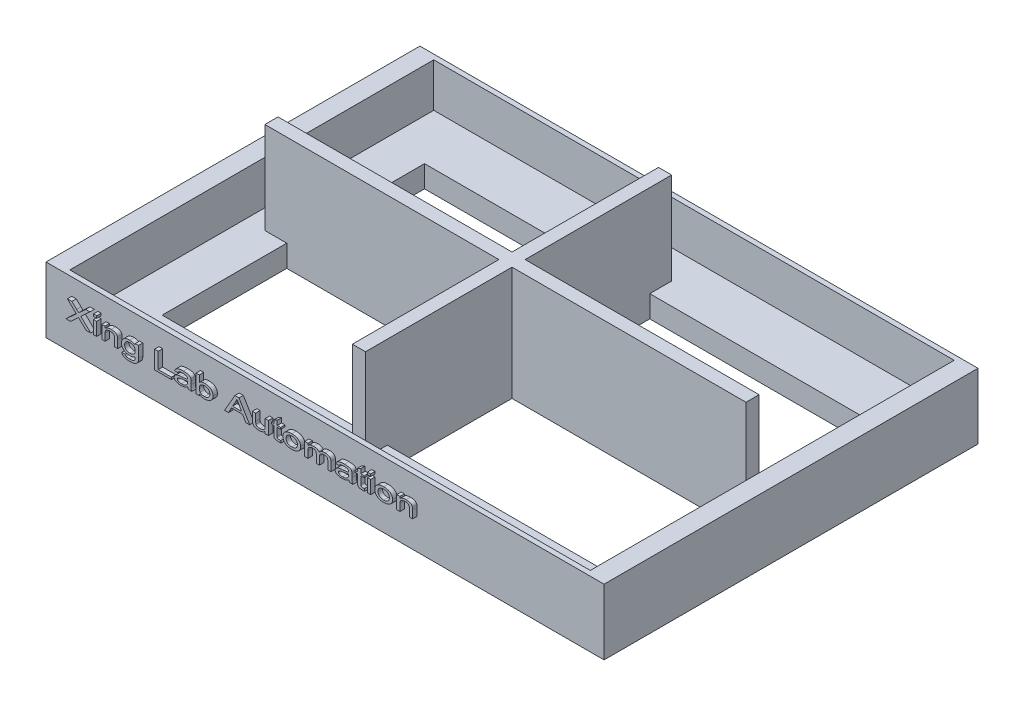
from build123d import *

# Parameters (mm, degrees)
SKETCH_1_W       = 119
SKETCH_1_H       = 83.205034796
EXTRUDE_2_DEPTH  = 5
SKETCH_1_4_W     = 127.6
SKETCH_1_4_H     = 85.5
SKETCH_1_4_W_2   = 119
SKETCH_1_4_H_2   = 83.205034796
EXTRUDE_3_DEPTH  = 15
SKETCH_2_W       = 0.737568443
SKETCH_2_H       = 0.526834602
SKETCH_2_H_2     = 3.002957231
EXTRUDE_4_DEPTH  = 1
EXTRUDE_11_DEPTH = 26


with BuildPart() as part:
    # 草图1 → 凸台-拉伸2 (new body)
    with BuildSketch(Plane(origin=(0, 0, 0), x_dir=(1, 0, 0), z_dir=(0, 1, 0))):
        with Locations((0, 0.002380306)):
            Rectangle(SKETCH_1_W, SKETCH_1_H)
        Polygon((-1.5, -30), (-50, -30), (-50, -1.5), (-55, -1.5), (-55, 1.5), (-50, 1.5), (-50, 30), (-1.5, 30), (-1.5, 35), (1.5, 35), (1.5, 30), (50, 30), (50, 1.5), (55, 1.5), (55, -1.5), (50, -1.5), (50, -30), (1.5, -30), (1.5, -35), (-1.5, -35), align=None, mode=Mode.SUBTRACT)
    extrude(amount=EXTRUDE_2_DEPTH)

    # 草图1<4> → 凸台-拉伸3 (add)
    with BuildSketch(Plane(origin=(0, 0, 0), x_dir=(1, 0, 0), z_dir=(0, 1, 0))):
        Rectangle(SKETCH_1_4_W, SKETCH_1_4_H)
        with Locations((0, 0.002380306)):
            Rectangle(SKETCH_1_4_W_2, SKETCH_1_4_H_2, mode=Mode.SUBTRACT)
    extrude(amount=EXTRUDE_3_DEPTH)

    # 草图2 → 凸台-拉伸4 (add)
    # profile 1 of 19: a face of its own
    with BuildSketch(Plane.XY.offset(42.75)):
        with BuildLine():
            Line((-58.222779565, 7.045312338), (-55.862725184, 9.196279236))
            Line((-55.862725184, 9.196279236), (-57.906678804, 11.154622233))
            Line((-57.906678804, 11.154622233), (-56.874412255, 11.154622233))
            Line((-56.874412255, 11.154622233), (-55.80427947, 10.129764297))
            add(Edge.make_bspline(
                [(-55.80427947, 10.129764297), (-55.776867338, 10.103394212), (-55.724000236, 10.052536806), (-55.647903293, 9.98020285), (-55.579463067, 9.913335505), (-55.516395577, 9.854894695), (-55.462075578, 9.800489435), (-55.411904616, 9.755522688), (-55.371374441, 9.714216062), (-55.345311007, 9.690365715), (-55.333421044, 9.679485348)],
                knots=[0, 0, 0, 0, 1.40115503, 2.702270826, 3.867471819, 4.92565285, 5.869199709, 6.698774859, 7.406389885, 8, 8, 8, 8], degree=3))
            add(Edge.make_bspline(
                [(-55.333421044, 9.679485348), (-55.305141704, 9.704985261), (-55.24353872, 9.760533615), (-55.14395698, 9.851109769), (-55.029786474, 9.955654593), (-54.948469984, 10.02963533), (-54.90536793, 10.068849046)],
                knots=[0, 0, 0, 0, 0.789667951, 1.720192303, 2.791580952, 4, 4, 4, 4], degree=3))
            Line((-54.90536793, 10.068849046), (-53.715051001, 11.154622233))
            Line((-53.715051001, 11.154622233), (-52.743699704, 11.154622233))
            Line((-52.743699704, 11.154622233), (-54.842806321, 9.207803743))
            Line((-54.842806321, 9.207803743), (-52.585649323, 7.045312338))
            Line((-52.585649323, 7.045312338), (-53.617915872, 7.045312338))
            Line((-53.617915872, 7.045312338), (-55.137504427, 8.501516105))
            add(Edge.make_bspline(
                [(-55.137504427, 8.501516105), (-55.17839724, 8.540745715), (-55.254720594, 8.613964826), (-55.330957702, 8.687273731), (-55.366348207, 8.721304915)],
                knots=[0, 0, 0, 0, 1.071567501, 2, 2, 2, 2], degree=3))
            add(Edge.make_bspline(
                [(-55.366348207, 8.721304915), (-55.400444233, 8.690101068), (-55.463041607, 8.632813487), (-55.54785454, 8.553223858), (-55.617042019, 8.489353876), (-55.657500542, 8.45132507), (-55.675040357, 8.434838601)],
                knots=[0, 0, 0, 0, 1.316971092, 2.417845725, 3.314095273, 4, 4, 4, 4], degree=3))
            Line((-55.675040357, 8.434838601), (-57.174049435, 7.045312338))
            Line((-57.174049435, 7.045312338), (-58.222779565, 7.045312338))
        make_face()
    # profile 2 of 19: a face of its own
    with BuildSketch(Plane.XY.offset(42.75)):
        with Locations((-51.569846357, 10.891204932)):
            Rectangle(SKETCH_2_W, SKETCH_2_H)
    # profile 3 of 19: a face of its own
    with BuildSketch(Plane.XY.offset(42.75)):
        with Locations((-51.569846357, 8.546790954)):
            Rectangle(SKETCH_2_W, SKETCH_2_H_2)
    # profile 4 of 19: a face of its own
    with BuildSketch(Plane.XY.offset(42.75)):
        with BuildLine():
            Line((-50.04202601, 7.045312338), (-50.04202601, 10.048269569))
            Line((-50.04202601, 10.048269569), (-49.304457567, 10.048269569))
            Line((-49.304457567, 10.048269569), (-49.304457567, 9.629271425))
            add(Edge.make_bspline(
                [(-49.304457567, 9.629271425), (-49.262781892, 9.66709552), (-49.178794098, 9.743321335), (-49.036115213, 9.839087135), (-48.880532784, 9.920256768), (-48.711877168, 9.987373705), (-48.529181407, 10.037443316), (-48.333798921, 10.074623075), (-48.125086331, 10.096971462), (-47.981389961, 10.099601207), (-47.907522693, 10.100953029)],
                knots=[0, 0, 0, 0, 0.892340397, 1.798307998, 2.717783362, 3.673708849, 4.673358127, 5.719693935, 6.827806306, 8, 8, 8, 8], degree=3))
            add(Edge.make_bspline(
                [(-47.907522693, 10.100953029), (-47.842723406, 10.099939814), (-47.715331487, 10.097947888), (-47.52852038, 10.07952472), (-47.349659241, 10.049196737), (-47.180955106, 10.00695563), (-47.026583712, 9.955131337), (-46.889750979, 9.897018592), (-46.775190683, 9.828343111), (-46.67985811, 9.752396211), (-46.602245405, 9.668282712), (-46.537504748, 9.577913154), (-46.484546056, 9.480110212), (-46.460259666, 9.410149475), (-46.44802621, 9.374909094)],
                knots=[0, 0, 0, 0, 1.334802986, 2.624151016, 3.863084231, 5.069710293, 6.203168805, 7.215753571, 8.126171055, 8.946409761, 9.71845364, 10.476206912, 11.2324402, 12, 12, 12, 12], degree=3))
            add(Edge.make_bspline(
                [(-46.44802621, 9.374909094), (-46.44456144, 9.362053485), (-46.437174024, 9.334643376), (-46.429037876, 9.289503302), (-46.423211805, 9.237730759), (-46.415748489, 9.17942795), (-46.412583049, 9.114520588), (-46.408784701, 9.043208519), (-46.407566679, 8.965242831), (-46.40710658, 8.9109098), (-46.406867256, 8.882648012)],
                knots=[0, 0, 0, 0, 0.644987449, 1.375211225, 2.219623254, 3.169655122, 4.222187575, 5.366930599, 6.630386613, 8, 8, 8, 8], degree=3))
            Line((-46.406867256, 8.882648012), (-46.406867256, 7.045312338))
            Line((-46.406867256, 7.045312338), (-47.144435699, 7.045312338))
            Line((-47.144435699, 7.045312338), (-47.144435699, 8.838196343))
            add(Edge.make_bspline(
                [(-47.144435699, 8.838196343), (-47.145494326, 8.885981394), (-47.147472893, 8.975291421), (-47.162943648, 9.100151411), (-47.19141169, 9.205807345), (-47.231073866, 9.295447315), (-47.287725988, 9.37024777), (-47.360225935, 9.435169154), (-47.450309371, 9.491755883), (-47.556641097, 9.539470025), (-47.675924438, 9.578230635), (-47.806179307, 9.607468355), (-47.946635555, 9.623433324), (-48.043583286, 9.625656045), (-48.093561162, 9.626801888)],
                knots=[0, 0, 0, 0, 1.204910874, 2.25197254, 3.163467592, 3.956008041, 4.707432073, 5.510772209, 6.397534482, 7.379034001, 8.442428638, 9.555405936, 10.739778475, 12, 12, 12, 12], degree=3))
            add(Edge.make_bspline(
                [(-48.093561162, 9.626801888), (-48.133906408, 9.626070366), (-48.21360045, 9.624625389), (-48.331115943, 9.61616461), (-48.444091447, 9.598750334), (-48.553346987, 9.578389954), (-48.657819123, 9.548844291), (-48.758533138, 9.514880544), (-48.854579305, 9.472985964), (-48.946342902, 9.426334566), (-49.031977288, 9.371132108), (-49.104688521, 9.301375722), (-49.167249842, 9.221784417), (-49.217915183, 9.130269509), (-49.25734719, 9.027490422), (-49.28484728, 8.913210415), (-49.301288897, 8.787911485), (-49.303373266, 8.700777986), (-49.304457567, 8.65545059)],
                knots=[0, 0, 0, 0, 1.089534928, 2.152160457, 3.177960772, 4.174747821, 5.150777213, 6.106746925, 7.042637586, 7.977119478, 8.885386807, 9.781638081, 10.684236735, 11.609687324, 12.594841562, 13.64786681, 14.776405496, 16, 16, 16, 16], degree=3))
            Line((-49.304457567, 8.65545059), (-49.304457567, 7.045312338))
            Line((-49.304457567, 7.045312338), (-50.04202601, 7.045312338))
        make_face()
    # profile 5 of 19: a face of its own
    with BuildSketch(Plane.XY.offset(42.75)):
        with BuildLine():
            Line((-45.45197954, 6.834578497), (-44.714411097, 6.781895037))
            add(Edge.make_bspline(
                [(-44.714411097, 6.781895037), (-44.710237173, 6.765267192), (-44.702046848, 6.732639031), (-44.681486266, 6.687049238), (-44.656886672, 6.644414494), (-44.626003644, 6.60573564), (-44.590407552, 6.570071035), (-44.549681026, 6.538000546), (-44.504265684, 6.508535525), (-44.470704906, 6.493351329), (-44.453463333, 6.485550573)],
                knots=[0, 0, 0, 0, 1.000066515, 1.962390866, 2.911259237, 3.870505427, 4.845704698, 5.850005269, 6.895457948, 8, 8, 8, 8], degree=3))
            add(Edge.make_bspline(
                [(-44.453463333, 6.485550573), (-44.428666572, 6.475183206), (-44.377658279, 6.453856967), (-44.29528789, 6.430454748), (-44.207525949, 6.407256646), (-44.112399038, 6.390992268), (-44.011482804, 6.376284631), (-43.903654827, 6.368370571), (-43.789537809, 6.360739936), (-43.710971427, 6.360533421), (-43.670620042, 6.360427355)],
                knots=[0, 0, 0, 0, 0.807576017, 1.661227995, 2.57188882, 3.536582376, 4.561249234, 5.637866165, 6.786817335, 8, 8, 8, 8], degree=3))
            add(Edge.make_bspline(
                [(-43.670620042, 6.360427355), (-43.627250814, 6.36052331), (-43.543201199, 6.36070927), (-43.421129533, 6.36840542), (-43.30644438, 6.376196655), (-43.199493114, 6.390973036), (-43.099693257, 6.40710546), (-43.008328415, 6.430321425), (-42.923606906, 6.453947402), (-42.846922633, 6.484180939), (-42.776456207, 6.517064198), (-42.712383625, 6.55319328), (-42.653760134, 6.592205491), (-42.601449866, 6.634710128), (-42.554743504, 6.680361593), (-42.514388855, 6.728846044), (-42.479800738, 6.780728696), (-42.461528146, 6.817622723), (-42.452315025, 6.836224855)],
                knots=[0, 0, 0, 0, 1.509157588, 2.924749178, 4.256469979, 5.508653603, 6.68158384, 7.772642171, 8.788092742, 9.74054915, 10.637771474, 11.493093977, 12.298374084, 13.085958602, 13.835625472, 14.568121415, 15.278040506, 16, 16, 16, 16], degree=3))
            add(Edge.make_bspline(
                [(-42.452315025, 6.836224855), (-42.447409484, 6.849317802), (-42.436639345, 6.878063434), (-42.424722969, 6.926912564), (-42.415238774, 6.985014229), (-42.406876477, 7.052548146), (-42.401703685, 7.129771516), (-42.397320948, 7.216209794), (-42.39605243, 7.31201975), (-42.3962403, 7.378974984), (-42.396338848, 7.414096559)],
                knots=[0, 0, 0, 0, 0.574715752, 1.26179139, 2.063357563, 2.995691196, 4.059541589, 5.245946624, 6.555352761, 8, 8, 8, 8], degree=3))
            add(Edge.make_bspline(
                [(-42.396338848, 7.414096559), (-42.438352049, 7.384478767), (-42.522454496, 7.325189573), (-42.658640557, 7.250417053), (-42.802169811, 7.186936683), (-42.953398203, 7.135045474), (-43.111989659, 7.094708442), (-43.277951759, 7.066166935), (-43.451542172, 7.048431964), (-43.569874364, 7.046366685), (-43.630284268, 7.045312338)],
                knots=[0, 0, 0, 0, 0.940830044, 1.883363045, 2.839568996, 3.812180627, 4.807975686, 5.83327226, 6.893861331, 8, 8, 8, 8], degree=3))
            add(Edge.make_bspline(
                [(-43.630284268, 7.045312338), (-43.704704653, 7.046347422), (-43.84975709, 7.0483649), (-44.060692299, 7.070629594), (-44.259028006, 7.104375085), (-44.444216468, 7.152900821), (-44.616451863, 7.21524676), (-44.775294162, 7.292447891), (-44.922439679, 7.381903847), (-45.054049066, 7.486692927), (-45.171545191, 7.60039186), (-45.275328707, 7.719547026), (-45.362346589, 7.845571084), (-45.433534878, 7.976967193), (-45.489241825, 8.113845641), (-45.529034085, 8.256275247), (-45.552290885, 8.404439979), (-45.555648766, 8.505002832), (-45.55734646, 8.555845923)],
                knots=[0, 0, 0, 0, 1.302582345, 2.538857382, 3.709456856, 4.822366588, 5.886318447, 6.911296292, 7.910005099, 8.895217221, 9.850004907, 10.769784429, 11.657366515, 12.525862541, 13.38146546, 14.239412316, 15.109872908, 16, 16, 16, 16], degree=3))
            add(Edge.make_bspline(
                [(-45.55734646, 8.555845923), (-45.556785445, 8.591269753), (-45.555673817, 8.661460563), (-45.544582663, 8.765740429), (-45.526438617, 8.867726003), (-45.501707501, 8.967564965), (-45.470363147, 9.065313369), (-45.431524268, 9.16104766), (-45.385285189, 9.254676219), (-45.332782871, 9.346342134), (-45.273001577, 9.433817304), (-45.20677014, 9.516718958), (-45.134106994, 9.594340851), (-45.054830732, 9.666611026), (-44.970002317, 9.734609439), (-44.878041612, 9.796322499), (-44.779999151, 9.852945795), (-44.676250926, 9.905012721), (-44.566675736, 9.950834197), (-44.452430662, 9.991284479), (-44.333028145, 10.024991497), (-44.209397351, 10.0529058), (-44.080735884, 10.074210945), (-43.947804622, 10.089887879), (-43.809862361, 10.098908692), (-43.716456493, 10.10026404), (-43.668973684, 10.100953029)],
                knots=[0, 0, 0, 0, 0.930704056, 1.844150468, 2.752315562, 3.651301076, 4.545268904, 5.447833748, 6.36375328, 7.287728051, 8.221806406, 9.145302659, 10.073853049, 11.012983965, 11.962385834, 12.928430141, 13.920396017, 14.936267491, 15.97691996, 17.039748281, 18.119445442, 19.235613089, 20.368979876, 21.5452169, 22.752112678, 24, 24, 24, 24], degree=3))
            add(Edge.make_bspline(
                [(-43.668973684, 10.100953029), (-43.60608376, 10.099741417), (-43.482727005, 10.097364875), (-43.301883806, 10.077136487), (-43.129207697, 10.044486498), (-42.964958978, 9.99846658), (-42.809370841, 9.939230038), (-42.662830428, 9.865875191), (-42.523570569, 9.78105684), (-42.438751051, 9.713343813), (-42.396338848, 9.679485348)],
                knots=[0, 0, 0, 0, 1.102195066, 2.161923522, 3.185490193, 4.179887977, 5.14824547, 6.099061533, 7.049475994, 8, 8, 8, 8], degree=3))
            Line((-42.396338848, 9.679485348), (-42.396338848, 10.048269569))
            Line((-42.396338848, 10.048269569), (-41.658770405, 10.048269569))
            Line((-41.658770405, 10.048269569), (-41.658770405, 7.489005854))
            add(Edge.make_bspline(
                [(-41.658770405, 7.489005854), (-41.65934311, 7.433560747), (-41.660446978, 7.326692252), (-41.670492676, 7.172589551), (-41.686162318, 7.030611302), (-41.710317998, 6.901526251), (-41.73903093, 6.784382754), (-41.776521378, 6.680538079), (-41.818302011, 6.587952791), (-41.870105465, 6.508358785), (-41.928425185, 6.436966561), (-41.993532556, 6.370413348), (-42.066338459, 6.307397066), (-42.147548175, 6.249303114), (-42.235590601, 6.19392486), (-42.331805774, 6.142976915), (-42.435541685, 6.095054332), (-42.547371621, 6.052034721), (-42.665772758, 6.012083856), (-42.791546806, 5.978688094), (-42.92362119, 5.949840114), (-43.062697712, 5.927002306), (-43.207979734, 5.909036475), (-43.360095627, 5.896003138), (-43.518781106, 5.887402476), (-43.626979914, 5.88665653), (-43.682144549, 5.886276213)],
                knots=[0, 0, 0, 0, 1.331751205, 2.566903662, 3.708286618, 4.760664026, 5.719885332, 6.601797317, 7.409764718, 8.153937112, 8.875582325, 9.621387701, 10.387822022, 11.185506766, 12.017660392, 12.884641531, 13.7989424, 14.761058246, 15.761582995, 16.799305081, 17.885329325, 19.007982197, 20.183661604, 21.401080925, 22.674953792, 24, 24, 24, 24], degree=3))
            add(Edge.make_bspline(
                [(-43.682144549, 5.886276213), (-43.747198152, 5.88671099), (-43.874396055, 5.887561099), (-44.060258393, 5.899936178), (-44.23677898, 5.917010292), (-44.403408573, 5.943920246), (-44.560741165, 5.976328516), (-44.708674074, 6.016223693), (-44.846376393, 6.065399895), (-44.974439688, 6.119414973), (-45.090293693, 6.181248355), (-45.190329271, 6.252136353), (-45.275363429, 6.330084264), (-45.343233707, 6.416491744), (-45.396690599, 6.509909398), (-45.431686482, 6.611833137), (-45.452470005, 6.720941279), (-45.452145749, 6.796069155), (-45.45197954, 6.834578497)],
                knots=[0, 0, 0, 0, 1.394318853, 2.726281471, 3.991741937, 5.194796866, 6.342702213, 7.434384059, 8.476243584, 9.474947068, 10.411998632, 11.285227617, 12.096844667, 12.875897124, 13.631798085, 14.392717757, 15.176132951, 16, 16, 16, 16], degree=3))
        make_face()
        with BuildLine():
            add(Edge.make_bspline(
                [(-44.819778018, 8.592065802), (-44.818580062, 8.547024922), (-44.816256941, 8.459679952), (-44.801012868, 8.333264085), (-44.773891629, 8.216520041), (-44.735966783, 8.109252579), (-44.687165858, 8.011287605), (-44.627731785, 7.922442589), (-44.556873758, 7.843424689), (-44.475804255, 7.774446184), (-44.386627842, 7.714671332), (-44.291571606, 7.662945853), (-44.19159864, 7.618005706), (-44.085748073, 7.581872103), (-43.974485533, 7.553918854), (-43.857736716, 7.534541587), (-43.735938177, 7.521668641), (-43.652818366, 7.520207096), (-43.61052797, 7.519463479)],
                knots=[0, 0, 0, 0, 1.176720128, 2.281939986, 3.320025913, 4.301809522, 5.247548094, 6.172074633, 7.085894869, 8.011171485, 8.945649562, 9.885638082, 10.835497302, 11.805776729, 12.803757513, 13.829067201, 14.895454547, 16, 16, 16, 16], degree=3))
            add(Edge.make_bspline(
                [(-43.61052797, 7.519463479), (-43.568249945, 7.520317013), (-43.485454364, 7.521988537), (-43.363731405, 7.533248861), (-43.247722309, 7.554079736), (-43.136841458, 7.582089352), (-43.030947704, 7.617348364), (-42.930134794, 7.661151722), (-42.834457012, 7.713045739), (-42.744643064, 7.772760757), (-42.662666731, 7.841190084), (-42.589882925, 7.918514908), (-42.531100195, 8.007290397), (-42.480642915, 8.103146304), (-42.443508446, 8.209015679), (-42.414841556, 8.322939528), (-42.399933741, 8.4465211), (-42.397562477, 8.531665599), (-42.396338848, 8.575602221)],
                knots=[0, 0, 0, 0, 1.111496976, 2.176710881, 3.209708351, 4.206976273, 5.181041069, 6.140573195, 7.092810464, 8.039154864, 8.971092712, 9.89503937, 10.819408339, 11.761509144, 12.735894426, 13.761155494, 14.844702057, 16, 16, 16, 16], degree=3))
            add(Edge.make_bspline(
                [(-42.396338848, 8.575602221), (-42.39743961, 8.617913081), (-42.399571393, 8.699854076), (-42.416188934, 8.818843999), (-42.444130738, 8.929876773), (-42.483284239, 9.033331158), (-42.53527827, 9.128035804), (-42.597103463, 9.21538257), (-42.671116691, 9.293883281), (-42.755336361, 9.363692419), (-42.847705974, 9.424603022), (-42.944449874, 9.479409913), (-43.046745243, 9.524495561), (-43.152710748, 9.562773811), (-43.263842323, 9.591429555), (-43.379421895, 9.611902689), (-43.499667599, 9.624513441), (-43.581411629, 9.626031741), (-43.622875656, 9.626801888)],
                knots=[0, 0, 0, 0, 1.114720679, 2.15881507, 3.158470241, 4.126692766, 5.065049969, 5.998098572, 6.939404404, 7.899492284, 8.874173644, 9.851827785, 10.826106723, 11.816434219, 12.81789229, 13.846243382, 14.907523623, 16, 16, 16, 16], degree=3))
            add(Edge.make_bspline(
                [(-43.622875656, 9.626801888), (-43.663790405, 9.626034622), (-43.744165554, 9.624527363), (-43.862244333, 9.611973701), (-43.975215445, 9.591204078), (-44.084014681, 9.563698994), (-44.187646265, 9.525884225), (-44.287833314, 9.482336419), (-44.381722379, 9.427602004), (-44.471522717, 9.36781308), (-44.553357877, 9.298827874), (-44.624531015, 9.220928759), (-44.685028337, 9.135472429), (-44.735335257, 9.042326431), (-44.77267867, 8.940404174), (-44.799769079, 8.831110348), (-44.816556653, 8.714136429), (-44.818683101, 8.633556647), (-44.819778018, 8.592065802)],
                knots=[0, 0, 0, 0, 1.100126261, 2.161147634, 3.188798452, 4.18750765, 5.1748108, 6.152581528, 7.120950933, 8.093136588, 9.05121713, 9.991368739, 10.922967255, 11.860566936, 12.829610889, 13.833649184, 14.884537489, 16, 16, 16, 16], degree=3))
        make_face(mode=Mode.SUBTRACT)
    # profile 6 of 19: a face of its own
    with BuildSketch(Plane.XY.offset(42.75)):
        Polygon((-37.977513624, 7.045312338), (-37.977513624, 11.154622233), (-37.134578261, 11.154622233), (-37.134578261, 7.519463479), (-34.131621029, 7.519463479), (-34.131621029, 7.045312338), align=None)
    # profile 7 of 19: a face of its own
    with BuildSketch(Plane.XY.offset(42.75)):
        with BuildLine():
            add(Edge.make_bspline(
                [(-30.391095355, 7.414096559), (-30.459280017, 7.377602847), (-30.592450612, 7.306327442), (-30.794494964, 7.215693164), (-30.992127584, 7.141943478), (-31.18723304, 7.085056748), (-31.383576368, 7.043776556), (-31.584544515, 7.014443369), (-31.79260876, 6.995574826), (-31.933691665, 6.993621166), (-32.005349502, 6.992628877)],
                knots=[0, 0, 0, 0, 1.099122326, 2.146681806, 3.145131152, 4.095639367, 5.032808011, 5.994867275, 6.981567089, 8, 8, 8, 8], degree=3))
            add(Edge.make_bspline(
                [(-32.005349502, 6.992628877), (-32.063534327, 6.99353618), (-32.176711038, 6.995300997), (-32.341360238, 7.00555517), (-32.495812842, 7.024475309), (-32.63978484, 7.050820367), (-32.773817231, 7.083031856), (-32.896840487, 7.124298146), (-33.009561719, 7.172896882), (-33.111582636, 7.228553189), (-33.20219009, 7.290506074), (-33.281912448, 7.355812509), (-33.348502024, 7.426640386), (-33.40341858, 7.501162515), (-33.447165181, 7.580047866), (-33.477405124, 7.663699148), (-33.496450476, 7.751290689), (-33.498420944, 7.811045095), (-33.499419507, 7.841326494)],
                knots=[0, 0, 0, 0, 1.467352503, 2.854182901, 4.157889263, 5.388888655, 6.543520828, 7.631035463, 8.656833932, 9.635406056, 10.55664219, 11.421336781, 12.229029369, 13.001295773, 13.750686536, 14.494980542, 15.237309901, 16, 16, 16, 16], degree=3))
            add(Edge.make_bspline(
                [(-33.499419507, 7.841326494), (-33.497818623, 7.87720368), (-33.494640021, 7.948438934), (-33.46467463, 8.05181294), (-33.419260338, 8.150778735), (-33.353846048, 8.242371283), (-33.275114106, 8.327668194), (-33.183558304, 8.404203057), (-33.082035665, 8.473380383), (-32.968193619, 8.531026489), (-32.845707746, 8.581599663), (-32.715339677, 8.62595942), (-32.577661908, 8.664116633), (-32.48265067, 8.68345867), (-32.434225796, 8.693316827)],
                knots=[0, 0, 0, 0, 0.871887231, 1.731158875, 2.60120008, 3.513317807, 4.45918451, 5.421829971, 6.413476087, 7.44468695, 8.52321132, 9.63908277, 10.796698974, 12, 12, 12, 12], degree=3))
            add(Edge.make_bspline(
                [(-32.434225796, 8.693316827), (-32.414752349, 8.696657203), (-32.373669194, 8.703704398), (-32.308423389, 8.713857766), (-32.236082742, 8.722153432), (-32.157209129, 8.732770765), (-32.071174063, 8.741064923), (-31.978280902, 8.751632913), (-31.87804704, 8.760196616), (-31.808884026, 8.76603707), (-31.773213006, 8.769049301)],
                knots=[0, 0, 0, 0, 0.7124815, 1.503123103, 2.380626033, 3.337901957, 4.372682653, 5.497061812, 6.709102535, 8, 8, 8, 8], degree=3))
            add(Edge.make_bspline(
                [(-31.773213006, 8.769049301), (-31.700769525, 8.775313269), (-31.560511144, 8.787440984), (-31.357611053, 8.805756372), (-31.169670047, 8.826484811), (-30.996856347, 8.848110809), (-30.838344041, 8.868902511), (-30.694852658, 8.892034342), (-30.566016237, 8.915447308), (-30.485711037, 8.933442726), (-30.44789471, 8.941916905)],
                knots=[0, 0, 0, 0, 1.30468558, 2.52601179, 3.655261562, 4.697057442, 5.650966829, 6.52351024, 7.304709779, 8, 8, 8, 8], degree=3))
            add(Edge.make_bspline(
                [(-30.44789471, 8.941916905), (-30.44739133, 8.956461913), (-30.446479398, 8.982811943), (-30.444667574, 9.017913316), (-30.443660812, 9.044259772), (-30.443745335, 9.058807923), (-30.443778815, 9.064570586)],
                knots=[0, 0, 0, 0, 1.422878145, 2.577714779, 3.436619076, 4, 4, 4, 4], degree=3))
            add(Edge.make_bspline(
                [(-30.443778815, 9.064570586), (-30.444353888, 9.087658898), (-30.445461872, 9.132142723), (-30.455541992, 9.19624132), (-30.471885157, 9.255209895), (-30.494915376, 9.309050029), (-30.524652736, 9.357813059), (-30.562545854, 9.399671344), (-30.605564318, 9.437666594), (-30.638526609, 9.457708099), (-30.655335835, 9.467928328)],
                knots=[0, 0, 0, 0, 1.1536287, 2.222675128, 3.234567423, 4.205458348, 5.141915443, 6.074950024, 7.018314641, 8, 8, 8, 8], degree=3))
            add(Edge.make_bspline(
                [(-30.655335835, 9.467928328), (-30.68034767, 9.48079545), (-30.732256818, 9.507499661), (-30.817900899, 9.538681264), (-30.911194763, 9.566872757), (-31.013654121, 9.588874786), (-31.12444516, 9.605874164), (-31.244235259, 9.618049542), (-31.372504174, 9.625487613), (-31.46094326, 9.626355033), (-31.506502989, 9.626801888)],
                knots=[0, 0, 0, 0, 0.771401897, 1.600954748, 2.496984787, 3.445485948, 4.474542614, 5.572519321, 6.749474194, 8, 8, 8, 8], degree=3))
            add(Edge.make_bspline(
                [(-31.506502989, 9.626801888), (-31.549038904, 9.626509939), (-31.631123053, 9.625946547), (-31.74999847, 9.620971796), (-31.860373827, 9.612864886), (-31.962311798, 9.601668311), (-32.055336619, 9.58664368), (-32.139981013, 9.57000814), (-32.215822199, 9.548463763), (-32.284281922, 9.523884816), (-32.346216926, 9.494529654), (-32.403262539, 9.460989094), (-32.455525717, 9.421572096), (-32.504292961, 9.378052504), (-32.548865054, 9.329164149), (-32.589553951, 9.275269787), (-32.625612624, 9.21608369), (-32.646116228, 9.173954115), (-32.656484143, 9.152650746)],
                knots=[0, 0, 0, 0, 1.538696914, 2.969317239, 4.303133498, 5.541808666, 6.677616391, 7.711329472, 8.660312252, 9.52702798, 10.339587239, 11.136288664, 11.916494485, 12.703740655, 13.497654562, 14.305653797, 15.143231738, 16, 16, 16, 16], degree=3))
            Line((-32.656484143, 9.152650746), (-33.394052586, 9.205334206))
            add(Edge.make_bspline(
                [(-33.394052586, 9.205334206), (-33.37595365, 9.255050702), (-33.340472816, 9.352514043), (-33.264494721, 9.486287538), (-33.17179546, 9.604315068), (-33.08222377, 9.691414203), (-33.00082299, 9.752591573), (-32.933353661, 9.796440165), (-32.858514633, 9.836278122), (-32.778554647, 9.875433755), (-32.691084448, 9.909335049), (-32.598355267, 9.942799917), (-32.498398536, 9.971962468), (-32.354629639, 10.008791876), (-32.162193077, 10.046752533), (-31.916915691, 10.078389562), (-31.654422239, 10.097212915), (-31.473607429, 10.099682258), (-31.380556591, 10.100953029)],
                knots=[0, 0, 0, 0, 1.072817813, 2.103133121, 3.107253628, 4.11199215, 4.628999136, 5.172949408, 5.743848997, 6.349363435, 6.97939556, 7.647212873, 8.350524322, 9.092344716, 10.660213573, 12.329047941, 14.110856293, 16, 16, 16, 16], degree=3))
            add(Edge.make_bspline(
                [(-31.380556591, 10.100953029), (-31.334180934, 10.100592094), (-31.24333245, 10.099885032), (-31.110499, 10.095687364), (-30.984213321, 10.089372283), (-30.864759628, 10.079714085), (-30.752067953, 10.066024474), (-30.645919846, 10.051935665), (-30.546494532, 10.033720467), (-30.453829152, 10.012183289), (-30.367082462, 9.989102825), (-30.286485224, 9.964781091), (-30.212096167, 9.93786515), (-30.14301824, 9.911429799), (-30.080188673, 9.882327679), (-30.023222797, 9.85234104), (-29.972863464, 9.819624669), (-29.912653667, 9.776729037), (-29.848143337, 9.714943891), (-29.781515892, 9.63371037), (-29.728460781, 9.542056261), (-29.703897437, 9.476024234), (-29.691393149, 9.442409777)],
                knots=[0, 0, 0, 0, 1.439796539, 2.820517066, 4.125690756, 5.365155513, 6.540178449, 7.649764385, 8.689071359, 9.67686088, 10.602604169, 11.475698901, 12.289422009, 13.058250654, 13.771044678, 14.438026885, 15.054810062, 15.634158552, 16.731081884, 17.815395527, 18.887898845, 20, 20, 20, 20], degree=3))
            add(Edge.make_bspline(
                [(-29.691393149, 9.442409777), (-29.68817706, 9.430654957), (-29.68120844, 9.405184619), (-29.674435643, 9.362940506), (-29.667826019, 9.314368504), (-29.662005922, 9.259209994), (-29.657979502, 9.197152017), (-29.655849686, 9.128515293), (-29.654110963, 9.053328615), (-29.653726973, 9.001186958), (-29.653526912, 8.974020889)],
                knots=[0, 0, 0, 0, 0.620412976, 1.344310591, 2.176564568, 3.118193958, 4.168877629, 5.343785579, 6.616098728, 8, 8, 8, 8], degree=3))
            Line((-29.653526912, 8.974020889), (-29.653526912, 8.294898159))
            add(Edge.make_bspline(
                [(-29.653526912, 8.294898159), (-29.653306122, 8.238372844), (-29.652885969, 8.130807758), (-29.651458858, 7.977685924), (-29.648414621, 7.841285219), (-29.643148799, 7.721117467), (-29.638071792, 7.617312221), (-29.630407902, 7.52979475), (-29.622945189, 7.458801786), (-29.609907891, 7.386032524), (-29.586776008, 7.306889832), (-29.549013151, 7.217179606), (-29.501597682, 7.128982777), (-29.462586963, 7.073476177), (-29.442793071, 7.045312338)],
                knots=[0, 0, 0, 0, 1.574527015, 2.996252761, 4.265399722, 5.374618653, 6.346784129, 7.159883148, 7.821631042, 8.334355502, 9.217307448, 10.111567109, 11.041816277, 12, 12, 12, 12], degree=3))
            Line((-29.442793071, 7.045312338), (-30.180361514, 7.045312338))
            add(Edge.make_bspline(
                [(-30.180361514, 7.045312338), (-30.206305348, 7.071962003), (-30.257155433, 7.124195522), (-30.316039248, 7.215341643), (-30.364242555, 7.310878758), (-30.382130738, 7.37963803), (-30.391095355, 7.414096559)],
                knots=[0, 0, 0, 0, 1.033656025, 2.025972594, 3.010721338, 4, 4, 4, 4], degree=3))
        make_face()
        with BuildLine():
            add(Edge.make_bspline(
                [(-30.443778815, 8.573132684), (-30.480470579, 8.563215646), (-30.557852348, 8.542300927), (-30.681642375, 8.515880536), (-30.818047748, 8.489572387), (-30.967372717, 8.464192502), (-31.129503056, 8.43931934), (-31.304965731, 8.416754753), (-31.493150496, 8.394217691), (-31.623094209, 8.381369139), (-31.69007192, 8.374746529)],
                knots=[0, 0, 0, 0, 0.721922124, 1.522510893, 2.403733928, 3.360953104, 4.399674802, 5.519511503, 6.721466088, 8, 8, 8, 8], degree=3))
            add(Edge.make_bspline(
                [(-31.69007192, 8.374746529), (-31.727955204, 8.371060829), (-31.800765151, 8.363977083), (-31.905248384, 8.351301281), (-32.001107356, 8.33931802), (-32.088313058, 8.32595715), (-32.167353219, 8.31282977), (-32.238019839, 8.300032631), (-32.29988164, 8.286256259), (-32.369176249, 8.266694982), (-32.445370825, 8.239789714), (-32.527386715, 8.201293662), (-32.597940811, 8.155157377), (-32.656822338, 8.102408537), (-32.703573841, 8.044653975), (-32.737002405, 7.983020629), (-32.758263896, 7.917883125), (-32.760646885, 7.873041145), (-32.761851064, 7.850381464)],
                knots=[0, 0, 0, 0, 1.403982305, 2.698390033, 3.882298214, 4.967366097, 5.952465249, 6.837879649, 7.616274152, 8.289204687, 9.492979422, 10.593097249, 11.623388323, 12.590910465, 13.498269283, 14.349707251, 15.166069194, 16, 16, 16, 16], degree=3))
            add(Edge.make_bspline(
                [(-32.761851064, 7.850381464), (-32.761397166, 7.833283272), (-32.76049315, 7.799229228), (-32.747725087, 7.749980467), (-32.731190778, 7.701911694), (-32.704451221, 7.657504212), (-32.672549313, 7.613855775), (-32.631616429, 7.574287338), (-32.584871587, 7.535534588), (-32.530701101, 7.499896807), (-32.469894753, 7.466593201), (-32.401367528, 7.439115228), (-32.327151094, 7.413970064), (-32.245300147, 7.395858663), (-32.157806361, 7.379808871), (-32.063163821, 7.369592564), (-31.962093115, 7.362882894), (-31.892311569, 7.361912915), (-31.856354091, 7.361413099)],
                knots=[0, 0, 0, 0, 0.720378718, 1.434760423, 2.139097264, 2.861060566, 3.614729439, 4.418215413, 5.258506159, 6.178238756, 7.153590206, 8.182862614, 9.293857899, 10.461033616, 11.721096359, 13.051482321, 14.480669103, 16, 16, 16, 16], degree=3))
            add(Edge.make_bspline(
                [(-31.856354091, 7.361413099), (-31.784936087, 7.362902236), (-31.645767796, 7.365804035), (-31.443258832, 7.390982772), (-31.252935914, 7.43164928), (-31.103685002, 7.480203001), (-30.99197839, 7.526277729), (-30.914649569, 7.564313198), (-30.842576732, 7.60446134), (-30.776523088, 7.648194137), (-30.716097883, 7.695114334), (-30.661902427, 7.745520843), (-30.612493184, 7.798132153), (-30.584451908, 7.8363642), (-30.570548391, 7.855320538)],
                knots=[0, 0, 0, 0, 1.801166242, 3.509832461, 5.139182318, 6.704404972, 7.461614056, 8.186060329, 8.877265603, 9.541567819, 10.182707247, 10.804842062, 11.407412898, 12, 12, 12, 12], degree=3))
            add(Edge.make_bspline(
                [(-30.570548391, 7.855320538), (-30.560544578, 7.87073835), (-30.539969455, 7.902448596), (-30.516058835, 7.955729057), (-30.494186482, 8.013550018), (-30.477351673, 8.076768439), (-30.464177302, 8.145284826), (-30.454397563, 8.218929356), (-30.448597024, 8.298096661), (-30.448133309, 8.352510721), (-30.44789471, 8.380508782)],
                knots=[0, 0, 0, 0, 0.80506362, 1.655796908, 2.554556615, 3.515177287, 4.520741764, 5.613568228, 6.77209193, 8, 8, 8, 8], degree=3))
            Line((-30.44789471, 8.380508782), (-30.443778815, 8.573132684))
        make_face(mode=Mode.SUBTRACT)
    # profile 8 of 19: a face of its own
    with BuildSketch(Plane.XY.offset(42.75)):
        with BuildLine():
            Line((-27.756922344, 7.045312338), (-28.494490787, 7.045312338))
            Line((-28.494490787, 7.045312338), (-28.494490787, 11.154622233))
            Line((-28.494490787, 11.154622233), (-27.756922344, 11.154622233))
            Line((-27.756922344, 11.154622233), (-27.756922344, 9.64244229))
            add(Edge.make_bspline(
                [(-27.756922344, 9.64244229), (-27.715686233, 9.679308716), (-27.633844951, 9.752477488), (-27.498428852, 9.845515089), (-27.35482114, 9.924171882), (-27.203335406, 9.989325904), (-27.043152274, 10.039980202), (-26.874586879, 10.074741291), (-26.697797469, 10.096758379), (-26.577098822, 10.099536687), (-26.515568313, 10.100953029)],
                knots=[0, 0, 0, 0, 0.977757563, 1.940554762, 2.898641239, 3.870682322, 4.853248164, 5.865290131, 6.911754298, 8, 8, 8, 8], degree=3))
            add(Edge.make_bspline(
                [(-26.515568313, 10.100953029), (-26.446631926, 10.099887686), (-26.310609461, 10.097785594), (-26.109621112, 10.075056329), (-25.914159163, 10.041145883), (-25.725958964, 9.992752456), (-25.548505376, 9.932715094), (-25.385392486, 9.861576122), (-25.239143984, 9.778224595), (-25.109650088, 9.682484539), (-24.994528287, 9.576777444), (-24.893282435, 9.460298289), (-24.804641613, 9.333838975), (-24.730143473, 9.197356951), (-24.669799076, 9.053817235), (-24.626723394, 8.904139851), (-24.600359404, 8.749409305), (-24.597405823, 8.644304098), (-24.595914732, 8.591242623)],
                knots=[0, 0, 0, 0, 1.208265405, 2.384099963, 3.5421602, 4.684603166, 5.787707206, 6.823860827, 7.80018826, 8.732662222, 9.641806186, 10.535269982, 11.433565791, 12.344388739, 13.256697295, 14.15815726, 15.070161273, 16, 16, 16, 16], degree=3))
            add(Edge.make_bspline(
                [(-24.595914732, 8.591242623), (-24.597659452, 8.529413258), (-24.601072383, 8.408465842), (-24.627543999, 8.232456161), (-24.672176385, 8.067331177), (-24.73400366, 7.912778915), (-24.8143609, 7.769511312), (-24.91282406, 7.637283263), (-25.028492487, 7.515745705), (-25.161522462, 7.407273664), (-25.305660184, 7.309985473), (-25.458332214, 7.225084534), (-25.617955879, 7.152940933), (-25.785043609, 7.094769545), (-25.958801411, 7.048133761), (-26.140130424, 7.01681511), (-26.327955571, 6.996197515), (-26.455694366, 6.993830082), (-26.520507388, 6.992628877)],
                knots=[0, 0, 0, 0, 1.056441619, 2.066556626, 3.033555351, 3.974081829, 4.904226994, 5.832798438, 6.784806514, 7.764155861, 8.760503601, 9.75350152, 10.746322237, 11.750453719, 12.774236792, 13.817438326, 14.892596282, 16, 16, 16, 16], degree=3))
            add(Edge.make_bspline(
                [(-26.520507388, 6.992628877), (-26.584506478, 6.99428402), (-26.70936532, 6.997513116), (-26.891439172, 7.020488975), (-27.062700461, 7.060012985), (-27.223454313, 7.115150154), (-27.373623169, 7.186501563), (-27.513313406, 7.273099991), (-27.642552382, 7.375831098), (-27.718562828, 7.455423897), (-27.756922344, 7.495591287)],
                knots=[0, 0, 0, 0, 1.115319119, 2.175928669, 3.192146744, 4.17369932, 5.132049526, 6.083561856, 7.032848198, 8, 8, 8, 8], degree=3))
            Line((-27.756922344, 7.495591287), (-27.756922344, 7.045312338))
        make_face()
        with BuildLine():
            add(Edge.make_bspline(
                [(-27.756922344, 8.568193609), (-27.756417704, 8.527282095), (-27.755443778, 8.448325331), (-27.744443869, 8.334472862), (-27.72746978, 8.229605794), (-27.703921507, 8.13326313), (-27.672490457, 8.04564197), (-27.635006142, 7.966437817), (-27.590443478, 7.895626554), (-27.554190709, 7.855403026), (-27.536310355, 7.835564241)],
                knots=[0, 0, 0, 0, 1.252470525, 2.417192845, 3.498841117, 4.503566248, 5.449769494, 6.344264849, 7.18336914, 8, 8, 8, 8], degree=3))
            add(Edge.make_bspline(
                [(-27.536310355, 7.835564241), (-27.505689715, 7.805986228), (-27.444681325, 7.747055163), (-27.341535716, 7.672470714), (-27.231392549, 7.608355061), (-27.112862965, 7.556412933), (-26.986454846, 7.516159484), (-26.852202865, 7.487484234), (-26.710033534, 7.469874842), (-26.612481235, 7.467828625), (-26.56248952, 7.466780019)],
                knots=[0, 0, 0, 0, 0.953367827, 1.899484694, 2.844821374, 3.806035168, 4.794267259, 5.813765251, 6.879640698, 8, 8, 8, 8], degree=3))
            add(Edge.make_bspline(
                [(-26.56248952, 7.466780019), (-26.521560851, 7.467450706), (-26.44058306, 7.468777667), (-26.321598692, 7.482918634), (-26.206192037, 7.502467257), (-26.096153849, 7.533712677), (-25.98963434, 7.571429855), (-25.887743723, 7.618355844), (-25.790192764, 7.674005316), (-25.69710304, 7.736765665), (-25.611511864, 7.808521139), (-25.536801531, 7.889849839), (-25.473607659, 7.979465607), (-25.422572491, 8.077673055), (-25.381598721, 8.183507837), (-25.354359844, 8.298464789), (-25.336512619, 8.421107989), (-25.33450961, 8.505839937), (-25.333483175, 8.549260491)],
                knots=[0, 0, 0, 0, 1.063653351, 2.104449013, 3.112070372, 4.10388203, 5.074292161, 6.047975186, 7.016100852, 7.991690168, 8.963672663, 9.912976329, 10.855175457, 11.806193442, 12.784049785, 13.798066567, 14.871627874, 16, 16, 16, 16], degree=3))
            add(Edge.make_bspline(
                [(-25.333483175, 8.549260491), (-25.334594284, 8.593763641), (-25.336755921, 8.680343481), (-25.353288061, 8.805548917), (-25.380328349, 8.921731131), (-25.417935968, 9.029009278), (-25.468019033, 9.126910338), (-25.528004073, 9.216397707), (-25.599692974, 9.296563841), (-25.682531793, 9.365808039), (-25.772071643, 9.426935319), (-25.866114861, 9.481236513), (-25.965567334, 9.525141436), (-26.069023021, 9.562921378), (-26.177413546, 9.591222143), (-26.2901985, 9.611939976), (-26.407444746, 9.624537387), (-26.487274572, 9.62603795), (-26.527915999, 9.626801888)],
                knots=[0, 0, 0, 0, 1.172449849, 2.280973832, 3.320999251, 4.31127443, 5.268448283, 6.211008777, 7.142942796, 8.091915716, 9.048597856, 9.997460584, 10.948936923, 11.90954572, 12.896965854, 13.896803547, 14.929261008, 16, 16, 16, 16], degree=3))
            add(Edge.make_bspline(
                [(-26.527915999, 9.626801888), (-26.568838403, 9.626099188), (-26.649803797, 9.624708889), (-26.768927904, 9.611024548), (-26.883981492, 9.58978886), (-26.994596904, 9.559975869), (-27.101220934, 9.522514395), (-27.202922269, 9.474696578), (-27.30122986, 9.420030471), (-27.393567305, 9.35578932), (-27.479503917, 9.285476208), (-27.553547431, 9.205153665), (-27.616590966, 9.117647625), (-27.667655058, 9.021940992), (-27.708694073, 8.919443737), (-27.735888935, 8.808855886), (-27.75397061, 8.691167724), (-27.755919503, 8.60997363), (-27.756922344, 8.568193609)],
                knots=[0, 0, 0, 0, 1.076704338, 2.130270525, 3.15155853, 4.153641622, 5.142758237, 6.121830915, 7.108122269, 8.099766848, 9.079025968, 10.0244643, 10.966448232, 11.910008939, 12.872939663, 13.864373824, 14.901071482, 16, 16, 16, 16], degree=3))
        make_face(mode=Mode.SUBTRACT)
    # profile 9 of 19: a face of its own
    with BuildSketch(Plane.XY.offset(42.75)):
        Polygon((-21.959272185, 7.045312338), (-19.607449594, 11.154622233), (-18.690428115, 11.154622233), (-16.216775023, 7.045312338), (-17.114863383, 7.045312338), (-17.819504664, 8.309715383), (-20.397701497, 8.309715383), (-21.066122899, 7.045312338), align=None)
        with BuildLine():
            Line((-20.145808703, 8.783866524), (-18.085391502, 8.783866524))
            Line((-18.085391502, 8.783866524), (-18.684665862, 9.857292026))
            add(Edge.make_bspline(
                [(-18.684665862, 9.857292026), (-18.707951434, 9.899295227), (-18.753333809, 9.981157291), (-18.820188628, 10.100266773), (-18.882604756, 10.213275846), (-18.941867678, 10.319470177), (-18.997927355, 10.418874101), (-19.049825629, 10.511873461), (-19.097446504, 10.598527848), (-19.128331542, 10.653870398), (-19.143176601, 10.680471092)],
                knots=[0, 0, 0, 0, 1.22324671, 2.384044489, 3.478993058, 4.511491318, 5.481547101, 6.385746022, 7.224100153, 8, 8, 8, 8], degree=3))
            add(Edge.make_bspline(
                [(-19.143176601, 10.680471092), (-19.166831679, 10.617986043), (-19.214816255, 10.491234459), (-19.296922978, 10.302404558), (-19.386578743, 10.110593041), (-19.452251638, 9.983569362), (-19.485619093, 9.919030456)],
                knots=[0, 0, 0, 0, 0.959498805, 1.946353512, 2.956571724, 4, 4, 4, 4], degree=3))
            Line((-19.485619093, 9.919030456), (-20.145808703, 8.783866524))
        make_face(mode=Mode.SUBTRACT)
    # profile 10 of 19: a face of its own
    with BuildSketch(Plane.XY.offset(42.75)):
        with BuildLine():
            Line((-12.689452726, 7.045312338), (-12.689452726, 7.535927061))
            add(Edge.make_bspline(
                [(-12.689452726, 7.535927061), (-12.733204138, 7.492305937), (-12.820137271, 7.405631684), (-12.967512944, 7.29524401), (-13.125794798, 7.201684183), (-13.295440564, 7.124640351), (-13.476717826, 7.065725143), (-13.669025012, 7.022768908), (-13.873025688, 6.996911468), (-14.013048236, 6.994079086), (-14.084741243, 6.992628877)],
                knots=[0, 0, 0, 0, 0.961047374, 1.909580863, 2.857777489, 3.819584375, 4.804562292, 5.820406475, 6.884025352, 8, 8, 8, 8], degree=3))
            add(Edge.make_bspline(
                [(-14.084741243, 6.992628877), (-14.148451459, 6.993900944), (-14.273961669, 6.996406936), (-14.459053321, 7.016044728), (-14.638106326, 7.046607347), (-14.807817621, 7.091149828), (-14.964201209, 7.142700121), (-15.100794085, 7.203778666), (-15.216830273, 7.26984352), (-15.312522569, 7.34428325), (-15.389388932, 7.427918717), (-15.453373388, 7.518331159), (-15.505455108, 7.617424033), (-15.529534475, 7.688383531), (-15.541768189, 7.724435067)],
                knots=[0, 0, 0, 0, 1.312068318, 2.584796937, 3.829967901, 5.050050954, 6.195756992, 7.217851214, 8.127155698, 8.940155915, 9.704027323, 10.458324315, 11.216739429, 12, 12, 12, 12], degree=3))
            add(Edge.make_bspline(
                [(-15.541768189, 7.724435067), (-15.54894303, 7.752860381), (-15.56493115, 7.816202185), (-15.576908625, 7.924220475), (-15.586499572, 8.053252065), (-15.586853009, 8.146697805), (-15.587043038, 8.196939851)],
                knots=[0, 0, 0, 0, 0.738320001, 1.645242031, 2.733940592, 4, 4, 4, 4], degree=3))
            Line((-15.587043038, 8.196939851), (-15.587043038, 10.048269569))
            Line((-15.587043038, 10.048269569), (-14.849474595, 10.048269569))
            Line((-14.849474595, 10.048269569), (-14.849474595, 8.415082303))
            add(Edge.make_bspline(
                [(-14.849474595, 8.415082303), (-14.849370288, 8.383797615), (-14.849170789, 8.323961738), (-14.846203726, 8.238094389), (-14.843846887, 8.160331491), (-14.837314766, 8.090437498), (-14.831598713, 8.02852139), (-14.822745454, 7.974581944), (-14.814911195, 7.928234273), (-14.805866196, 7.900794861), (-14.801730209, 7.888247701)],
                knots=[0, 0, 0, 0, 1.414532032, 2.705469422, 3.885245162, 4.931104475, 5.879299453, 6.695288413, 7.4033974, 8, 8, 8, 8], degree=3))
            add(Edge.make_bspline(
                [(-14.801730209, 7.888247701), (-14.787507899, 7.856392184), (-14.758753232, 7.791986696), (-14.687764072, 7.708924002), (-14.598980626, 7.635278891), (-14.489652354, 7.574375416), (-14.363489888, 7.52684861), (-14.223055874, 7.491052763), (-14.068570802, 7.471153236), (-13.961045248, 7.468273367), (-13.905288206, 7.466780019)],
                knots=[0, 0, 0, 0, 0.793680314, 1.604662927, 2.468614835, 3.420681825, 4.449022146, 5.542599918, 6.725722821, 8, 8, 8, 8], degree=3))
            add(Edge.make_bspline(
                [(-13.905288206, 7.466780019), (-13.84787615, 7.468239167), (-13.734568974, 7.471118909), (-13.56724214, 7.492950678), (-13.405625044, 7.529355088), (-13.275477156, 7.570743051), (-13.177348838, 7.611209643), (-13.108846513, 7.64327192), (-13.046372886, 7.678903417), (-12.988759992, 7.716275255), (-12.936984285, 7.756821689), (-12.892057204, 7.800873667), (-12.850890526, 7.846043367), (-12.815930099, 7.895305386), (-12.786359644, 7.948885193), (-12.759375415, 8.006564727), (-12.738637167, 8.070651891), (-12.720285764, 8.139813429), (-12.706441555, 8.214957009), (-12.697103173, 8.295547414), (-12.689832888, 8.3814767), (-12.689582053, 8.440583846), (-12.689452726, 8.471058479)],
                knots=[0, 0, 0, 0, 1.903356927, 3.756423533, 5.584120489, 7.391091229, 8.276459012, 9.10262438, 9.897120133, 10.659228002, 11.378242881, 12.073194976, 12.743405974, 13.402343745, 14.070451631, 14.770743656, 15.510192386, 16.300247391, 17.14253821, 18.040854792, 18.989898258, 20, 20, 20, 20], degree=3))
            Line((-12.689452726, 8.471058479), (-12.689452726, 10.048269569))
            Line((-12.689452726, 10.048269569), (-11.951884284, 10.048269569))
            Line((-11.951884284, 10.048269569), (-11.951884284, 7.045312338))
            Line((-11.951884284, 7.045312338), (-12.689452726, 7.045312338))
        make_face()
    # profile 11 of 19: a face of its own
    with BuildSketch(Plane.XY.offset(42.75)):
        with BuildLine():
            Line((-9.159660893, 7.479950884), (-9.054293972, 7.037903726))
            add(Edge.make_bspline(
                [(-9.054293972, 7.037903726), (-9.106385996, 7.030935275), (-9.207657175, 7.017388032), (-9.355971121, 7.003971993), (-9.495650427, 6.993768399), (-9.586050494, 6.992999909), (-9.629696139, 6.992628877)],
                knots=[0, 0, 0, 0, 1.091698821, 2.122352307, 3.093461456, 4, 4, 4, 4], degree=3))
            add(Edge.make_bspline(
                [(-9.629696139, 6.992628877), (-9.663177207, 6.992984638), (-9.728518011, 6.993678931), (-9.823489912, 6.997897511), (-9.912792898, 7.004032004), (-9.99619845, 7.014291075), (-10.074094716, 7.025981333), (-10.145989614, 7.041906582), (-10.212009605, 7.059811676), (-10.290141929, 7.086477418), (-10.376551452, 7.125562204), (-10.466558191, 7.180281057), (-10.539655034, 7.242823541), (-10.589042306, 7.30217385), (-10.617933424, 7.358516696), (-10.636587963, 7.410267432), (-10.65267979, 7.471706351), (-10.665793526, 7.543245723), (-10.675065436, 7.624676166), (-10.682651786, 7.716079359), (-10.686384609, 7.817424042), (-10.687104618, 7.888245609), (-10.687481239, 7.925290759)],
                knots=[0, 0, 0, 0, 1.196115279, 2.334308285, 3.395922772, 4.392980045, 5.335793397, 6.208747583, 7.022093496, 7.778506999, 9.156085693, 10.401980727, 11.527992932, 12.581292307, 13.133745013, 13.781998105, 14.542908266, 15.400424476, 16.378015605, 17.469709097, 18.676462409, 20, 20, 20, 20], degree=3))
            Line((-10.687481239, 7.925290759), (-10.687481239, 9.679485348))
            Line((-10.687481239, 9.679485348), (-11.266999301, 9.679485348))
            Line((-11.266999301, 9.679485348), (-11.266999301, 10.048269569))
            Line((-11.266999301, 10.048269569), (-10.687481239, 10.048269569))
            Line((-10.687481239, 10.048269569), (-10.687481239, 10.77925258))
            Line((-10.687481239, 10.77925258), (-9.949912796, 11.078889759))
            Line((-9.949912796, 11.078889759), (-9.949912796, 10.048269569))
            Line((-9.949912796, 10.048269569), (-9.159660893, 10.048269569))
            Line((-9.159660893, 10.048269569), (-9.159660893, 9.679485348))
            Line((-9.159660893, 9.679485348), (-9.949912796, 9.679485348))
            Line((-9.949912796, 9.679485348), (-9.949912796, 7.890717238))
            add(Edge.make_bspline(
                [(-9.949912796, 7.890717238), (-9.949687037, 7.856933388), (-9.9492787, 7.795827416), (-9.940879032, 7.714429455), (-9.930342103, 7.651856681), (-9.911701713, 7.606057752), (-9.885367123, 7.573029624), (-9.853155285, 7.547061718), (-9.815878161, 7.522788478), (-9.771420495, 7.502009375), (-9.718389124, 7.485353201), (-9.65586912, 7.474535465), (-9.583457034, 7.468158033), (-9.532027322, 7.467259616), (-9.504572921, 7.466780019)],
                knots=[0, 0, 0, 0, 1.652972756, 2.989786727, 4.004181413, 4.750387916, 5.381966772, 6.049394158, 6.768627047, 7.555911347, 8.443930775, 9.482155447, 10.655914828, 12, 12, 12, 12], degree=3))
            add(Edge.make_bspline(
                [(-9.504572921, 7.466780019), (-9.480973358, 7.466959656), (-9.430470491, 7.467344078), (-9.349517742, 7.470048315), (-9.258137783, 7.474147881), (-9.193681266, 7.477946147), (-9.159660893, 7.479950884)],
                knots=[0, 0, 0, 0, 0.820349724, 1.75554154, 2.815367036, 4, 4, 4, 4], degree=3))
        make_face()
    # profile 12 of 19: a face of its own
    with BuildSketch(Plane.XY.offset(42.75)):
        with BuildLine():
            add(Edge.make_bspline(
                [(-8.632826291, 8.546790953), (-8.632434024, 8.580559919), (-8.631657846, 8.647378584), (-8.623036209, 8.745741416), (-8.610042899, 8.840851538), (-8.591702076, 8.932602592), (-8.569234105, 9.02139717), (-8.539916488, 9.10642612), (-8.506430657, 9.188377649), (-8.466582278, 9.266530657), (-8.422363378, 9.341548028), (-8.372373831, 9.412947782), (-8.317322359, 9.481123352), (-8.256996473, 9.546177669), (-8.192095607, 9.608434806), (-8.120510686, 9.665593028), (-8.045367434, 9.721317026), (-7.991560559, 9.754241597), (-7.964404889, 9.770858224)],
                knots=[0, 0, 0, 0, 1.105219902, 2.186899025, 3.229877873, 4.246370511, 5.248593214, 6.225785947, 7.188335769, 8.144450996, 9.094979808, 10.0369384, 10.995119083, 11.961350436, 12.939863478, 13.935948417, 14.958298483, 16, 16, 16, 16], degree=3))
            add(Edge.make_bspline(
                [(-7.964404889, 9.770858224), (-7.917087621, 9.797493315), (-7.821670175, 9.851204199), (-7.669325305, 9.916965592), (-7.510157231, 9.974001664), (-7.343527473, 10.020977927), (-7.169142511, 10.05727374), (-6.987038685, 10.08214498), (-6.797436047, 10.098488785), (-6.668481734, 10.100122007), (-6.602866715, 10.100953029)],
                knots=[0, 0, 0, 0, 0.918663286, 1.852526752, 2.804616062, 3.779581214, 4.780795249, 5.817427557, 6.889455255, 8, 8, 8, 8], degree=3))
            add(Edge.make_bspline(
                [(-6.602866715, 10.100953029), (-6.530124344, 10.099552019), (-6.387703269, 10.096809005), (-6.179045103, 10.079370728), (-5.980987647, 10.046491226), (-5.79263276, 10.003926724), (-5.61520888, 9.946271989), (-5.446735999, 9.878676822), (-5.289744708, 9.795642749), (-5.142899012, 9.702639586), (-5.010585355, 9.597643311), (-4.89407906, 9.482685856), (-4.795189926, 9.357707637), (-4.714538556, 9.222394407), (-4.652762319, 9.077113091), (-4.607976194, 8.922713582), (-4.581359705, 8.758719229), (-4.577944029, 8.646219641), (-4.576199855, 8.588773086)],
                knots=[0, 0, 0, 0, 1.230537168, 2.409248186, 3.537801133, 4.624260761, 5.672297542, 6.690219687, 7.69088486, 8.671972119, 9.626628112, 10.542306678, 11.434643439, 12.315022211, 13.198722626, 14.097673923, 15.028600168, 16, 16, 16, 16], degree=3))
            add(Edge.make_bspline(
                [(-4.576199855, 8.588773086), (-4.577025436, 8.542104484), (-4.578630665, 8.451363726), (-4.590040194, 8.319029459), (-4.609908241, 8.194492234), (-4.636551833, 8.077314927), (-4.672050922, 7.96791153), (-4.715831296, 7.86634431), (-4.766922527, 7.772003709), (-4.82571248, 7.684912481), (-4.892605034, 7.604592148), (-4.965794955, 7.528597092), (-5.04677969, 7.457970217), (-5.134700701, 7.391509304), (-5.229909966, 7.330402075), (-5.332059182, 7.273011194), (-5.441269913, 7.220639355), (-5.557136984, 7.173274432), (-5.677694493, 7.130544831), (-5.801928734, 7.093649939), (-5.928836636, 7.062320874), (-6.058226582, 7.036850158), (-6.190337477, 7.016920931), (-6.325250597, 7.003473548), (-6.463053263, 6.993540473), (-6.555926985, 6.992934929), (-6.602866715, 6.992628877)],
                knots=[0, 0, 0, 0, 1.149148554, 2.234363273, 3.267443097, 4.252473448, 5.190497883, 6.095451877, 6.972272054, 7.828705013, 8.678260386, 9.543154048, 10.424129793, 11.321433654, 12.254774037, 13.207695004, 14.204977677, 15.23513669, 16.288695459, 17.35331116, 18.425064411, 19.506359624, 20.599538252, 21.71358691, 22.844413588, 24, 24, 24, 24], degree=3))
            add(Edge.make_bspline(
                [(-6.602866715, 6.992628877), (-6.676713524, 6.993992733), (-6.821339597, 6.996663791), (-7.032863633, 7.014610408), (-7.233534412, 7.045406121), (-7.422869231, 7.090456603), (-7.601813852, 7.145780817), (-7.770055494, 7.214218744), (-7.926973795, 7.296082596), (-8.072577935, 7.389501716), (-8.205001014, 7.494059016), (-8.319352687, 7.612034661), (-8.416820831, 7.740631928), (-8.496352704, 7.880636707), (-8.557444974, 8.031907673), (-8.600984827, 8.193853348), (-8.627778902, 8.366723898), (-8.631116034, 8.485777033), (-8.632826291, 8.546790953)],
                knots=[0, 0, 0, 0, 1.229023496, 2.406994192, 3.530223676, 4.604713252, 5.643235489, 6.644801187, 7.623224985, 8.584705098, 9.520450798, 10.424731532, 11.311616373, 12.199241662, 13.096483643, 14.019324674, 14.984917395, 16, 16, 16, 16], degree=3))
        make_face()
        with BuildLine():
            add(Edge.make_bspline(
                [(-7.895257848, 8.548437312), (-7.894234947, 8.504471136), (-7.892250974, 8.419196324), (-7.874542901, 8.295615195), (-7.846241484, 8.180567578), (-7.805341096, 8.074410796), (-7.754435861, 7.975875494), (-7.690133651, 7.886896803), (-7.61585898, 7.804871888), (-7.528632893, 7.734272201), (-7.434200176, 7.670712558), (-7.332391633, 7.616583608), (-7.225021143, 7.570315496), (-7.11182384, 7.532446317), (-6.992898392, 7.502904229), (-6.868038967, 7.481356858), (-6.737019143, 7.469098299), (-6.647618028, 7.467562786), (-6.602043536, 7.466780019)],
                knots=[0, 0, 0, 0, 1.105523056, 2.144222691, 3.133678101, 4.079780591, 4.999916243, 5.915509398, 6.8339864, 7.775266764, 8.730616367, 9.694185303, 10.671283242, 11.668868047, 12.693480305, 13.751159315, 14.853596271, 16, 16, 16, 16], degree=3))
            add(Edge.make_bspline(
                [(-6.602043536, 7.466780019), (-6.557005057, 7.467449783), (-6.46837419, 7.468767807), (-6.338650569, 7.482706803), (-6.214161954, 7.502766717), (-6.095603698, 7.532111685), (-5.983386391, 7.571439317), (-5.876312668, 7.617115277), (-5.775804728, 7.672833473), (-5.680801688, 7.735686821), (-5.594389445, 7.807756109), (-5.518432997, 7.888834594), (-5.455288144, 7.980075218), (-5.403670103, 8.079774051), (-5.362693125, 8.188272792), (-5.33440967, 8.30578054), (-5.31683336, 8.432112449), (-5.314808509, 8.519291777), (-5.313768298, 8.564077714)],
                knots=[0, 0, 0, 0, 1.127531751, 2.21886083, 3.263879518, 4.283902948, 5.272731057, 6.239145458, 7.195638082, 8.146709057, 9.088173134, 10.007198838, 10.920347832, 11.85781566, 12.812529221, 13.817557835, 14.878831476, 16, 16, 16, 16], degree=3))
            add(Edge.make_bspline(
                [(-5.313768298, 8.564077714), (-5.314816556, 8.606396037), (-5.316861079, 8.688933714), (-5.334429454, 8.808723209), (-5.362996681, 8.920669651), (-5.403498363, 9.024426003), (-5.455793818, 9.120355097), (-5.520466901, 9.207723725), (-5.596214147, 9.287603233), (-5.682801145, 9.358949665), (-5.778133225, 9.421371047), (-5.878788355, 9.47725146), (-5.985688285, 9.523180037), (-6.098002125, 9.561158534), (-6.216124447, 9.590677401), (-6.339890835, 9.612162444), (-6.469259503, 9.624468925), (-6.557291732, 9.626015616), (-6.602043536, 9.626801888)],
                knots=[0, 0, 0, 0, 1.077625264, 2.101800847, 3.076697676, 4.015228496, 4.931844248, 5.851812413, 6.77646939, 7.7296721, 8.702938561, 9.675903733, 10.658961552, 11.662557553, 12.693367406, 13.757554766, 14.860037179, 16, 16, 16, 16], degree=3))
            add(Edge.make_bspline(
                [(-6.602043536, 9.626801888), (-6.6476161, 9.62601151), (-6.737013432, 9.624461068), (-6.868060424, 9.612309738), (-6.99275775, 9.590389441), (-7.111967138, 9.56223685), (-7.224957684, 9.523937456), (-7.332682602, 9.478080978), (-7.433683167, 9.422559579), (-7.528954521, 9.36033895), (-7.615546811, 9.289481074), (-7.690132176, 9.208397028), (-7.75464568, 9.120042055), (-7.805311407, 9.021622659), (-7.846249889, 8.915488992), (-7.874540643, 8.800434736), (-7.892212019, 8.677127679), (-7.89422377, 8.592128513), (-7.895257848, 8.548437312)],
                knots=[0, 0, 0, 0, 1.147822219, 2.251623264, 3.310610982, 4.334836706, 5.333655862, 6.311962802, 7.280011017, 8.232714718, 9.175159765, 10.089694688, 11.000801974, 11.922076147, 12.869349286, 13.860028989, 14.900013847, 16, 16, 16, 16], degree=3))
        make_face(mode=Mode.SUBTRACT)
    # profile 13 of 19: a face of its own
    with BuildSketch(Plane.XY.offset(42.75)):
        with BuildLine():
            Line((-3.641068436, 7.045312338), (-3.641068436, 10.048269569))
            Line((-3.641068436, 10.048269569), (-2.903499994, 10.048269569))
            Line((-2.903499994, 10.048269569), (-2.903499994, 9.579880681))
            add(Edge.make_bspline(
                [(-2.903499994, 9.579880681), (-2.868022291, 9.618285928), (-2.796017629, 9.696232261), (-2.666778077, 9.794810385), (-2.523625443, 9.884665639), (-2.363931587, 9.9617291), (-2.189869641, 10.023878113), (-2.003250034, 10.069570356), (-1.804755483, 10.095768601), (-1.668534144, 10.099196996), (-1.598761175, 10.100953029)],
                knots=[0, 0, 0, 0, 0.865248364, 1.756086529, 2.68374181, 3.664297311, 4.688689175, 5.742254241, 6.843576006, 8, 8, 8, 8], degree=3))
            add(Edge.make_bspline(
                [(-1.598761175, 10.100953029), (-1.559788488, 10.10042915), (-1.483707584, 10.099406453), (-1.372170967, 10.092881964), (-1.266077743, 10.081606815), (-1.1655908, 10.064946872), (-1.070344262, 10.044712795), (-0.980612052, 10.018877705), (-0.895585971, 9.989795693), (-0.816348186, 9.954768945), (-0.742462279, 9.916560322), (-0.674513012, 9.874018906), (-0.611553012, 9.829005318), (-0.554424153, 9.779461034), (-0.503479714, 9.72551345), (-0.457043574, 9.669073391), (-0.417045911, 9.608199139), (-0.394899151, 9.565272945), (-0.383748874, 9.543660802)],
                knots=[0, 0, 0, 0, 1.326191537, 2.588937498, 3.800521036, 4.954876393, 6.053745325, 7.111871215, 8.130663641, 9.109076559, 10.05712227, 10.958787719, 11.834753253, 12.688541397, 13.527288177, 14.357047378, 15.172819086, 16, 16, 16, 16], degree=3))
            add(Edge.make_bspline(
                [(-0.383748874, 9.543660802), (-0.339218865, 9.588435985), (-0.25102136, 9.677119092), (-0.101723376, 9.789157568), (0.055044156, 9.887115514), (0.223419325, 9.965137118), (0.401352262, 10.026309557), (0.589149052, 10.069953211), (0.786925605, 10.095573773), (0.922012029, 10.099135251), (0.990960166, 10.100953029)],
                knots=[0, 0, 0, 0, 0.991181691, 1.963164969, 2.925332944, 3.891791147, 4.872259696, 5.877421601, 6.916635573, 8, 8, 8, 8], degree=3))
            add(Edge.make_bspline(
                [(0.990960166, 10.100953029), (1.044489757, 10.100152426), (1.148658672, 10.098594447), (1.300068102, 10.086865704), (1.442064384, 10.068572635), (1.574314215, 10.04121923), (1.69712522, 10.006926249), (1.810689693, 9.965314684), (1.914067419, 9.914588128), (2.00857086, 9.857462583), (2.092431493, 9.791162915), (2.16552771, 9.716528801), (2.227863239, 9.633698964), (2.278477482, 9.542246394), (2.31705182, 9.442416236), (2.345221573, 9.334500709), (2.361497602, 9.218176441), (2.363710343, 9.137884316), (2.364846027, 9.096674569)],
                knots=[0, 0, 0, 0, 1.327150511, 2.582643121, 3.763289556, 4.874788358, 5.928038593, 6.922630931, 7.868951849, 8.779118322, 9.655735492, 10.512132744, 11.362590725, 12.218366155, 13.09519452, 14.009420632, 14.978339762, 16, 16, 16, 16], degree=3))
            Line((2.364846027, 9.096674569), (2.364846027, 7.045312338))
            Line((2.364846027, 7.045312338), (1.627277584, 7.045312338))
            Line((1.627277584, 7.045312338), (1.627277584, 8.90240431))
            add(Edge.make_bspline(
                [(1.627277584, 8.90240431), (1.626252222, 8.948790829), (1.624348355, 9.034920149), (1.612799287, 9.154178209), (1.589024105, 9.252321464), (1.557230222, 9.333573251), (1.509288695, 9.399214491), (1.449234513, 9.456944977), (1.372480394, 9.505755239), (1.283322013, 9.548973585), (1.182450726, 9.583852198), (1.072155343, 9.609470085), (0.953215588, 9.624112069), (0.871090782, 9.62588749), (0.82879389, 9.626801888)],
                knots=[0, 0, 0, 0, 1.330141556, 2.469773287, 3.425545388, 4.218773506, 4.952100181, 5.736504575, 6.59386636, 7.547207911, 8.572106485, 9.646286435, 10.787762495, 12, 12, 12, 12], degree=3))
            add(Edge.make_bspline(
                [(0.82879389, 9.626801888), (0.790076589, 9.626238211), (0.714431733, 9.625136915), (0.603467322, 9.614507817), (0.497330565, 9.599907796), (0.396383179, 9.575997352), (0.300065912, 9.547889146), (0.208979033, 9.512184402), (0.123041248, 9.470112262), (0.042532723, 9.421894521), (-0.031549335, 9.367213866), (-0.095598677, 9.303124605), (-0.149167612, 9.231040517), (-0.193554392, 9.151401131), (-0.228072139, 9.064264132), (-0.251497122, 8.968966583), (-0.266820999, 8.866406078), (-0.268472904, 8.795175886), (-0.269326983, 8.758347973)],
                knots=[0, 0, 0, 0, 1.169159246, 2.284272958, 3.365034481, 4.402531004, 5.414755721, 6.393685197, 7.353765542, 8.301893017, 9.225241754, 10.127821517, 11.027962282, 11.929628194, 12.874671139, 13.849662661, 14.888218124, 16, 16, 16, 16], degree=3))
            Line((-0.269326983, 8.758347973), (-0.269326983, 7.045312338))
            Line((-0.269326983, 7.045312338), (-1.006895426, 7.045312338))
            Line((-1.006895426, 7.045312338), (-1.006895426, 8.960850023))
            add(Edge.make_bspline(
                [(-1.006895426, 8.960850023), (-1.007643882, 8.987755347), (-1.009090935, 9.03977367), (-1.016937404, 9.11565136), (-1.03207507, 9.186008022), (-1.051184797, 9.251801436), (-1.077994733, 9.311581677), (-1.110303838, 9.366044724), (-1.147468179, 9.416346973), (-1.191653251, 9.461020673), (-1.242086139, 9.500839085), (-1.300016606, 9.534937507), (-1.364981412, 9.563477716), (-1.437616598, 9.586513403), (-1.517265729, 9.604248852), (-1.604453212, 9.617302606), (-1.698749649, 9.625712956), (-1.764201339, 9.626431277), (-1.797970508, 9.626801888)],
                knots=[0, 0, 0, 0, 1.085270483, 2.098244662, 3.070452471, 3.984033562, 4.855852521, 5.704111178, 6.533984338, 7.371201651, 8.230074711, 9.118172554, 10.074253026, 11.085533673, 12.186095536, 13.361329286, 14.638603262, 16, 16, 16, 16], degree=3))
            add(Edge.make_bspline(
                [(-1.797970508, 9.626801888), (-1.850187624, 9.625730931), (-1.953158166, 9.623619037), (-2.104386596, 9.601045469), (-2.25006963, 9.566831472), (-2.387853117, 9.519126585), (-2.514092386, 9.458480975), (-2.623598586, 9.383257646), (-2.714077155, 9.294144974), (-2.773341838, 9.208575875), (-2.812124631, 9.133717616), (-2.836560045, 9.070991136), (-2.856673567, 9.002551821), (-2.874535283, 8.928489909), (-2.886903174, 8.848312773), (-2.897071929, 8.762407283), (-2.902797213, 8.670620545), (-2.903260504, 8.607439357), (-2.903499994, 8.574779042)],
                knots=[0, 0, 0, 0, 1.424409775, 2.808892137, 4.164194054, 5.504970966, 6.781263272, 7.976000342, 9.114741124, 10.228474578, 10.801320104, 11.413324975, 12.062605401, 12.747544245, 13.491308277, 14.275463414, 15.108533548, 16, 16, 16, 16], degree=3))
            Line((-2.903499994, 8.574779042), (-2.903499994, 7.045312338))
            Line((-2.903499994, 7.045312338), (-3.641068436, 7.045312338))
        make_face()
    # profile 14 of 19: a face of its own
    with BuildSketch(Plane.XY.offset(42.75)):
        with BuildLine():
            add(Edge.make_bspline(
                [(6.434643327, 7.414096559), (6.366458665, 7.377602847), (6.23328807, 7.306327442), (6.031243717, 7.215693164), (5.833611098, 7.141943478), (5.638505642, 7.085056748), (5.442162314, 7.043776556), (5.241194167, 7.014443369), (5.033129922, 6.995574826), (4.892047017, 6.993621166), (4.82038918, 6.992628877)],
                knots=[0, 0, 0, 0, 1.099122326, 2.146681806, 3.145131152, 4.095639367, 5.032808011, 5.994867275, 6.981567089, 8, 8, 8, 8], degree=3))
            add(Edge.make_bspline(
                [(4.82038918, 6.992628877), (4.762204355, 6.99353618), (4.649027643, 6.995300997), (4.484378444, 7.00555517), (4.32992584, 7.024475309), (4.185953842, 7.050820367), (4.051921451, 7.083031856), (3.928898195, 7.124298146), (3.816176963, 7.172896882), (3.714156046, 7.228553189), (3.623548592, 7.290506074), (3.543826234, 7.355812509), (3.477236658, 7.426640386), (3.422320102, 7.501162515), (3.378573501, 7.580047866), (3.348333558, 7.663699148), (3.329288206, 7.751290689), (3.327317738, 7.811045095), (3.326319175, 7.841326494)],
                knots=[0, 0, 0, 0, 1.467352503, 2.854182901, 4.157889263, 5.388888655, 6.543520828, 7.631035463, 8.656833932, 9.635406056, 10.55664219, 11.421336781, 12.229029369, 13.001295773, 13.750686536, 14.494980542, 15.237309901, 16, 16, 16, 16], degree=3))
            add(Edge.make_bspline(
                [(3.326319175, 7.841326494), (3.327920059, 7.87720368), (3.331098661, 7.948438934), (3.361064052, 8.05181294), (3.406478344, 8.150778735), (3.471892634, 8.242371283), (3.550624576, 8.327668194), (3.642180378, 8.404203057), (3.743703017, 8.473380383), (3.857545063, 8.531026489), (3.980030936, 8.581599663), (4.110399005, 8.62595942), (4.248076774, 8.664116633), (4.343088012, 8.68345867), (4.391512886, 8.693316827)],
                knots=[0, 0, 0, 0, 0.871887231, 1.731158875, 2.60120008, 3.513317807, 4.45918451, 5.421829971, 6.413476087, 7.44468695, 8.52321132, 9.63908277, 10.796698974, 12, 12, 12, 12], degree=3))
            add(Edge.make_bspline(
                [(4.391512886, 8.693316827), (4.410986333, 8.696657203), (4.452069488, 8.703704398), (4.517315293, 8.713857766), (4.58965594, 8.722153432), (4.668529552, 8.732770765), (4.754564619, 8.741064923), (4.84745778, 8.751632913), (4.947691642, 8.760196616), (5.016854656, 8.76603707), (5.052525676, 8.769049301)],
                knots=[0, 0, 0, 0, 0.7124815, 1.503123103, 2.380626033, 3.337901957, 4.372682653, 5.497061812, 6.709102535, 8, 8, 8, 8], degree=3))
            add(Edge.make_bspline(
                [(5.052525676, 8.769049301), (5.124969157, 8.775313269), (5.265227538, 8.787440984), (5.468127629, 8.805756372), (5.656068635, 8.826484811), (5.828882335, 8.848110809), (5.987394641, 8.868902511), (6.130886024, 8.892034342), (6.259722445, 8.915447308), (6.340027645, 8.933442726), (6.377843972, 8.941916905)],
                knots=[0, 0, 0, 0, 1.30468558, 2.52601179, 3.655261562, 4.697057442, 5.650966829, 6.52351024, 7.304709779, 8, 8, 8, 8], degree=3))
            add(Edge.make_bspline(
                [(6.377843972, 8.941916905), (6.378347351, 8.956461913), (6.379259284, 8.982811943), (6.381071108, 9.017913316), (6.38207787, 9.044259772), (6.381993347, 9.058807923), (6.381959867, 9.064570586)],
                knots=[0, 0, 0, 0, 1.422878145, 2.577714779, 3.436619076, 4, 4, 4, 4], degree=3))
            add(Edge.make_bspline(
                [(6.381959867, 9.064570586), (6.381384793, 9.087658898), (6.38027681, 9.132142723), (6.37019669, 9.19624132), (6.353853525, 9.255209895), (6.330823306, 9.309050029), (6.301085946, 9.357813059), (6.263192828, 9.399671344), (6.220174364, 9.437666594), (6.187212073, 9.457708099), (6.170402847, 9.467928328)],
                knots=[0, 0, 0, 0, 1.1536287, 2.222675128, 3.234567423, 4.205458348, 5.141915443, 6.074950024, 7.018314641, 8, 8, 8, 8], degree=3))
            add(Edge.make_bspline(
                [(6.170402847, 9.467928328), (6.145391012, 9.48079545), (6.093481864, 9.507499661), (6.007837783, 9.538681264), (5.914543919, 9.566872757), (5.812084561, 9.588874786), (5.701293522, 9.605874164), (5.581503422, 9.618049542), (5.453234508, 9.625487613), (5.364795421, 9.626355033), (5.319235693, 9.626801888)],
                knots=[0, 0, 0, 0, 0.771401897, 1.600954748, 2.496984787, 3.445485948, 4.474542614, 5.572519321, 6.749474194, 8, 8, 8, 8], degree=3))
            add(Edge.make_bspline(
                [(5.319235693, 9.626801888), (5.276699778, 9.626509939), (5.194615629, 9.625946547), (5.075740212, 9.620971796), (4.965364855, 9.612864886), (4.863426884, 9.601668311), (4.770402063, 9.58664368), (4.685757669, 9.57000814), (4.609916483, 9.548463763), (4.54145676, 9.523884816), (4.479521755, 9.494529654), (4.422476143, 9.460989094), (4.370212964, 9.421572096), (4.321445721, 9.378052504), (4.276873628, 9.329164149), (4.23618473, 9.275269787), (4.200126058, 9.21608369), (4.179622454, 9.173954115), (4.169254539, 9.152650746)],
                knots=[0, 0, 0, 0, 1.538696914, 2.969317239, 4.303133498, 5.541808666, 6.677616391, 7.711329472, 8.660312252, 9.52702798, 10.339587239, 11.136288664, 11.916494485, 12.703740655, 13.497654562, 14.305653797, 15.143231738, 16, 16, 16, 16], degree=3))
            Line((4.169254539, 9.152650746), (3.431686096, 9.205334206))
            add(Edge.make_bspline(
                [(3.431686096, 9.205334206), (3.449785032, 9.255050702), (3.485265866, 9.352514043), (3.561243961, 9.486287538), (3.653943222, 9.604315068), (3.743514912, 9.691414203), (3.824915692, 9.752591573), (3.892385021, 9.796440165), (3.967224048, 9.836278122), (4.047184035, 9.875433755), (4.134654234, 9.909335049), (4.227383415, 9.942799917), (4.327340146, 9.971962468), (4.471109042, 10.008791876), (4.663545605, 10.046752533), (4.908822991, 10.078389562), (5.171316442, 10.097212915), (5.352131253, 10.099682258), (5.44518209, 10.100953029)],
                knots=[0, 0, 0, 0, 1.072817813, 2.103133121, 3.107253628, 4.11199215, 4.628999136, 5.172949408, 5.743848997, 6.349363435, 6.97939556, 7.647212873, 8.350524322, 9.092344716, 10.660213573, 12.329047941, 14.110856293, 16, 16, 16, 16], degree=3))
            add(Edge.make_bspline(
                [(5.44518209, 10.100953029), (5.491557748, 10.100592094), (5.582406232, 10.099885032), (5.715239682, 10.095687364), (5.841525361, 10.089372283), (5.960979054, 10.079714085), (6.073670729, 10.066024474), (6.179818836, 10.051935665), (6.27924415, 10.033720467), (6.371909529, 10.012183289), (6.45865622, 9.989102825), (6.539253457, 9.964781091), (6.613642514, 9.93786515), (6.682720442, 9.911429799), (6.745550009, 9.882327679), (6.802515885, 9.85234104), (6.852875218, 9.819624669), (6.913085014, 9.776729037), (6.977595345, 9.714943891), (7.04422279, 9.63371037), (7.097277901, 9.542056261), (7.121841245, 9.476024234), (7.134345533, 9.442409777)],
                knots=[0, 0, 0, 0, 1.439796539, 2.820517066, 4.125690756, 5.365155513, 6.540178449, 7.649764385, 8.689071359, 9.67686088, 10.602604169, 11.475698901, 12.289422009, 13.058250654, 13.771044678, 14.438026885, 15.054810062, 15.634158552, 16.731081884, 17.815395527, 18.887898845, 20, 20, 20, 20], degree=3))
            add(Edge.make_bspline(
                [(7.134345533, 9.442409777), (7.137561622, 9.430654957), (7.144530242, 9.405184619), (7.151303039, 9.362940506), (7.157912662, 9.314368504), (7.16373276, 9.259209994), (7.16775918, 9.197152017), (7.169888996, 9.128515293), (7.171627718, 9.053328615), (7.172011709, 9.001186958), (7.17221177, 8.974020889)],
                knots=[0, 0, 0, 0, 0.620412976, 1.344310591, 2.176564568, 3.118193958, 4.168877629, 5.343785579, 6.616098728, 8, 8, 8, 8], degree=3))
            Line((7.17221177, 8.974020889), (7.17221177, 8.294898159))
            add(Edge.make_bspline(
                [(7.17221177, 8.294898159), (7.17243256, 8.238372844), (7.172852713, 8.130807758), (7.174279824, 7.977685924), (7.177324061, 7.841285219), (7.182589883, 7.721117467), (7.18766689, 7.617312221), (7.19533078, 7.52979475), (7.202793493, 7.458801786), (7.215830791, 7.386032524), (7.238962674, 7.306889832), (7.276725531, 7.217179606), (7.324141, 7.128982777), (7.363151719, 7.073476177), (7.382945611, 7.045312338)],
                knots=[0, 0, 0, 0, 1.574527015, 2.996252761, 4.265399722, 5.374618653, 6.346784129, 7.159883148, 7.821631042, 8.334355502, 9.217307448, 10.111567109, 11.041816277, 12, 12, 12, 12], degree=3))
            Line((7.382945611, 7.045312338), (6.645377168, 7.045312338))
            add(Edge.make_bspline(
                [(6.645377168, 7.045312338), (6.619433334, 7.071962003), (6.568583249, 7.124195522), (6.509699433, 7.215341643), (6.461496127, 7.310878758), (6.443607944, 7.37963803), (6.434643327, 7.414096559)],
                knots=[0, 0, 0, 0, 1.033656025, 2.025972594, 3.010721338, 4, 4, 4, 4], degree=3))
        make_face()
        with BuildLine():
            add(Edge.make_bspline(
                [(6.381959867, 8.573132684), (6.345268103, 8.563215646), (6.267886334, 8.542300927), (6.144096307, 8.515880536), (6.007690933, 8.489572387), (5.858365965, 8.464192502), (5.696235626, 8.43931934), (5.520772951, 8.416754753), (5.332588186, 8.394217691), (5.202644473, 8.381369139), (5.135666762, 8.374746529)],
                knots=[0, 0, 0, 0, 0.721922124, 1.522510893, 2.403733928, 3.360953104, 4.399674802, 5.519511503, 6.721466088, 8, 8, 8, 8], degree=3))
            add(Edge.make_bspline(
                [(5.135666762, 8.374746529), (5.097783478, 8.371060829), (5.024973531, 8.363977083), (4.920490298, 8.351301281), (4.824631326, 8.33931802), (4.737425624, 8.32595715), (4.658385463, 8.31282977), (4.587718843, 8.300032631), (4.525857042, 8.286256259), (4.456562432, 8.266694982), (4.380367857, 8.239789714), (4.298351967, 8.201293662), (4.227797871, 8.155157377), (4.168916344, 8.102408537), (4.122164841, 8.044653975), (4.088736277, 7.983020629), (4.067474786, 7.917883125), (4.065091797, 7.873041145), (4.063887618, 7.850381464)],
                knots=[0, 0, 0, 0, 1.403982305, 2.698390033, 3.882298214, 4.967366097, 5.952465249, 6.837879649, 7.616274152, 8.289204687, 9.492979422, 10.593097249, 11.623388323, 12.590910465, 13.498269283, 14.349707251, 15.166069194, 16, 16, 16, 16], degree=3))
            add(Edge.make_bspline(
                [(4.063887618, 7.850381464), (4.064341516, 7.833283272), (4.065245532, 7.799229228), (4.078013594, 7.749980467), (4.094547904, 7.701911694), (4.121287461, 7.657504212), (4.153189369, 7.613855775), (4.194122252, 7.574287338), (4.240867095, 7.535534588), (4.295037581, 7.499896807), (4.355843928, 7.466593201), (4.424371154, 7.439115228), (4.498587588, 7.413970064), (4.580438534, 7.395858663), (4.667932321, 7.379808871), (4.762574861, 7.369592564), (4.863645567, 7.362882894), (4.933427113, 7.361912915), (4.96938459, 7.361413099)],
                knots=[0, 0, 0, 0, 0.720378718, 1.434760423, 2.139097264, 2.861060566, 3.614729439, 4.418215413, 5.258506159, 6.178238756, 7.153590206, 8.182862614, 9.293857899, 10.461033616, 11.721096359, 13.051482321, 14.480669103, 16, 16, 16, 16], degree=3))
            add(Edge.make_bspline(
                [(4.96938459, 7.361413099), (5.040802594, 7.362902236), (5.179970886, 7.365804035), (5.38247985, 7.390982772), (5.572802768, 7.43164928), (5.72205368, 7.480203001), (5.833760292, 7.526277729), (5.911089113, 7.564313198), (5.98316195, 7.60446134), (6.049215593, 7.648194137), (6.109640799, 7.695114334), (6.163836255, 7.745520843), (6.213245498, 7.798132153), (6.241286774, 7.8363642), (6.255190291, 7.855320538)],
                knots=[0, 0, 0, 0, 1.801166242, 3.509832461, 5.139182318, 6.704404972, 7.461614056, 8.186060329, 8.877265603, 9.541567819, 10.182707247, 10.804842062, 11.407412898, 12, 12, 12, 12], degree=3))
            add(Edge.make_bspline(
                [(6.255190291, 7.855320538), (6.265194104, 7.87073835), (6.285769227, 7.902448596), (6.309679847, 7.955729057), (6.3315522, 8.013550018), (6.348387009, 8.076768439), (6.36156138, 8.145284826), (6.371341119, 8.218929356), (6.377141658, 8.298096661), (6.377605373, 8.352510721), (6.377843972, 8.380508782)],
                knots=[0, 0, 0, 0, 0.80506362, 1.655796908, 2.554556615, 3.515177287, 4.520741764, 5.613568228, 6.77209193, 8, 8, 8, 8], degree=3))
            Line((6.377843972, 8.380508782), (6.381959867, 8.573132684))
        make_face(mode=Mode.SUBTRACT)
    # profile 15 of 19: a face of its own
    with BuildSketch(Plane.XY.offset(42.75)):
        with BuildLine():
            Line((9.964435161, 7.479950884), (10.069802081, 7.037903726))
            add(Edge.make_bspline(
                [(10.069802081, 7.037903726), (10.017710058, 7.030935275), (9.916438879, 7.017388032), (9.768124933, 7.003971993), (9.628445626, 6.993768399), (9.53804556, 6.992999909), (9.494399914, 6.992628877)],
                knots=[0, 0, 0, 0, 1.091698821, 2.122352307, 3.093461456, 4, 4, 4, 4], degree=3))
            add(Edge.make_bspline(
                [(9.494399914, 6.992628877), (9.460918847, 6.992984638), (9.395578043, 6.993678931), (9.300606142, 6.997897511), (9.211303156, 7.004032004), (9.127897603, 7.014291075), (9.050001337, 7.025981333), (8.97810644, 7.041906582), (8.912086449, 7.059811676), (8.833954125, 7.086477418), (8.747544601, 7.125562204), (8.657537862, 7.180281057), (8.58444102, 7.242823541), (8.535053748, 7.30217385), (8.506162629, 7.358516696), (8.487508091, 7.410267432), (8.471416264, 7.471706351), (8.458302528, 7.543245723), (8.449030617, 7.624676166), (8.441444267, 7.716079359), (8.437711445, 7.817424042), (8.436991436, 7.888245609), (8.436614815, 7.925290759)],
                knots=[0, 0, 0, 0, 1.196115279, 2.334308285, 3.395922772, 4.392980045, 5.335793397, 6.208747583, 7.022093496, 7.778506999, 9.156085693, 10.401980727, 11.527992932, 12.581292307, 13.133745013, 13.781998105, 14.542908266, 15.400424476, 16.378015605, 17.469709097, 18.676462409, 20, 20, 20, 20], degree=3))
            Line((8.436614815, 7.925290759), (8.436614815, 9.679485348))
            Line((8.436614815, 9.679485348), (7.857096753, 9.679485348))
            Line((7.857096753, 9.679485348), (7.857096753, 10.048269569))
            Line((7.857096753, 10.048269569), (8.436614815, 10.048269569))
            Line((8.436614815, 10.048269569), (8.436614815, 10.77925258))
            Line((8.436614815, 10.77925258), (9.174183258, 11.078889759))
            Line((9.174183258, 11.078889759), (9.174183258, 10.048269569))
            Line((9.174183258, 10.048269569), (9.964435161, 10.048269569))
            Line((9.964435161, 10.048269569), (9.964435161, 9.679485348))
            Line((9.964435161, 9.679485348), (9.174183258, 9.679485348))
            Line((9.174183258, 9.679485348), (9.174183258, 7.890717238))
            add(Edge.make_bspline(
                [(9.174183258, 7.890717238), (9.174409017, 7.856933388), (9.174817354, 7.795827416), (9.183217022, 7.714429455), (9.19375395, 7.651856681), (9.212394341, 7.606057752), (9.238728931, 7.573029624), (9.270940769, 7.547061718), (9.308217893, 7.522788478), (9.352675559, 7.502009375), (9.405706929, 7.485353201), (9.468226934, 7.474535465), (9.540639019, 7.468158033), (9.592068732, 7.467259616), (9.619523132, 7.466780019)],
                knots=[0, 0, 0, 0, 1.652972756, 2.989786727, 4.004181413, 4.750387916, 5.381966772, 6.049394158, 6.768627047, 7.555911347, 8.443930775, 9.482155447, 10.655914828, 12, 12, 12, 12], degree=3))
            add(Edge.make_bspline(
                [(9.619523132, 7.466780019), (9.643122695, 7.466959656), (9.693625562, 7.467344078), (9.774578312, 7.470048315), (9.86595827, 7.474147881), (9.930414788, 7.477946147), (9.964435161, 7.479950884)],
                knots=[0, 0, 0, 0, 0.820349724, 1.75554154, 2.815367036, 4, 4, 4, 4], degree=3))
        make_face()
    # profile 16 of 19: a face of its own
    with BuildSketch(Plane.XY.offset(42.75)):
        with Locations((11.070787826, 10.891204932)):
            Rectangle(SKETCH_2_W, SKETCH_2_H)
    # profile 17 of 19: a face of its own
    with BuildSketch(Plane.XY.offset(42.75)):
        with Locations((11.070787826, 8.546790954)):
            Rectangle(SKETCH_2_W, SKETCH_2_H_2)
    # profile 18 of 19: a face of its own
    with BuildSketch(Plane.XY.offset(42.75)):
        with BuildLine():
            add(Edge.make_bspline(
                [(12.38787433, 8.546790953), (12.388266597, 8.580559919), (12.389042775, 8.647378584), (12.397664412, 8.745741416), (12.410657722, 8.840851538), (12.428998545, 8.932602592), (12.451466516, 9.02139717), (12.480784133, 9.10642612), (12.514269964, 9.188377649), (12.554118343, 9.266530657), (12.598337243, 9.341548028), (12.64832679, 9.412947782), (12.703378262, 9.481123352), (12.763704148, 9.546177669), (12.828605014, 9.608434806), (12.900189935, 9.665593028), (12.975333187, 9.721317026), (13.029140062, 9.754241597), (13.056295732, 9.770858224)],
                knots=[0, 0, 0, 0, 1.105219902, 2.186899025, 3.229877873, 4.246370511, 5.248593214, 6.225785947, 7.188335769, 8.144450996, 9.094979808, 10.0369384, 10.995119083, 11.961350436, 12.939863478, 13.935948417, 14.958298483, 16, 16, 16, 16], degree=3))
            add(Edge.make_bspline(
                [(13.056295732, 9.770858224), (13.103613, 9.797493315), (13.199030446, 9.851204199), (13.351375316, 9.916965592), (13.51054339, 9.974001664), (13.677173148, 10.020977927), (13.85155811, 10.05727374), (14.033661936, 10.08214498), (14.223264574, 10.098488785), (14.352218887, 10.100122007), (14.417833906, 10.100953029)],
                knots=[0, 0, 0, 0, 0.918663286, 1.852526752, 2.804616062, 3.779581214, 4.780795249, 5.817427557, 6.889455255, 8, 8, 8, 8], degree=3))
            add(Edge.make_bspline(
                [(14.417833906, 10.100953029), (14.490576277, 10.099552019), (14.632997352, 10.096809005), (14.841655518, 10.079370728), (15.039712974, 10.046491226), (15.228067861, 10.003926724), (15.405491741, 9.946271989), (15.573964622, 9.878676822), (15.730955913, 9.795642749), (15.877801609, 9.702639586), (16.010115266, 9.597643311), (16.126621561, 9.482685856), (16.225510695, 9.357707637), (16.306162065, 9.222394407), (16.367938302, 9.077113091), (16.412724427, 8.922713582), (16.439340916, 8.758719229), (16.442756592, 8.646219641), (16.444500766, 8.588773086)],
                knots=[0, 0, 0, 0, 1.230537168, 2.409248186, 3.537801133, 4.624260761, 5.672297542, 6.690219687, 7.69088486, 8.671972119, 9.626628112, 10.542306678, 11.434643439, 12.315022211, 13.198722626, 14.097673923, 15.028600168, 16, 16, 16, 16], degree=3))
            add(Edge.make_bspline(
                [(16.444500766, 8.588773086), (16.443675185, 8.542104484), (16.442069956, 8.451363726), (16.430660427, 8.319029459), (16.41079238, 8.194492234), (16.384148788, 8.077314927), (16.348649699, 7.96791153), (16.304869325, 7.86634431), (16.253778094, 7.772003709), (16.194988141, 7.684912481), (16.128095587, 7.604592148), (16.054905666, 7.528597092), (15.973920931, 7.457970217), (15.88599992, 7.391509304), (15.790790655, 7.330402075), (15.688641439, 7.273011194), (15.579430708, 7.220639355), (15.463563637, 7.173274432), (15.343006128, 7.130544831), (15.218771887, 7.093649939), (15.091863985, 7.062320874), (14.962474039, 7.036850158), (14.830363144, 7.016920931), (14.695450024, 7.003473548), (14.557647358, 6.993540473), (14.464773636, 6.992934929), (14.417833906, 6.992628877)],
                knots=[0, 0, 0, 0, 1.149148554, 2.234363273, 3.267443097, 4.252473448, 5.190497883, 6.095451877, 6.972272054, 7.828705013, 8.678260386, 9.543154048, 10.424129793, 11.321433654, 12.254774037, 13.207695004, 14.204977677, 15.23513669, 16.288695459, 17.35331116, 18.425064411, 19.506359624, 20.599538252, 21.71358691, 22.844413588, 24, 24, 24, 24], degree=3))
            add(Edge.make_bspline(
                [(14.417833906, 6.992628877), (14.343987097, 6.993992733), (14.199361024, 6.996663791), (13.987836988, 7.014610408), (13.787166209, 7.045406121), (13.59783139, 7.090456603), (13.418886769, 7.145780817), (13.250645127, 7.214218744), (13.093726826, 7.296082596), (12.948122686, 7.389501716), (12.815699607, 7.494059016), (12.701347934, 7.612034661), (12.60387979, 7.740631928), (12.524347917, 7.880636707), (12.463255647, 8.031907673), (12.419715794, 8.193853348), (12.392921719, 8.366723898), (12.389584587, 8.485777033), (12.38787433, 8.546790953)],
                knots=[0, 0, 0, 0, 1.229023496, 2.406994192, 3.530223676, 4.604713252, 5.643235489, 6.644801187, 7.623224985, 8.584705098, 9.520450798, 10.424731532, 11.311616373, 12.199241662, 13.096483643, 14.019324674, 14.984917395, 16, 16, 16, 16], degree=3))
        make_face()
        with BuildLine():
            add(Edge.make_bspline(
                [(13.125442773, 8.548437312), (13.126465674, 8.504471136), (13.128449647, 8.419196324), (13.14615772, 8.295615195), (13.174459137, 8.180567578), (13.215359525, 8.074410796), (13.26626476, 7.975875494), (13.33056697, 7.886896803), (13.404841641, 7.804871888), (13.492067728, 7.734272201), (13.586500445, 7.670712558), (13.688308988, 7.616583608), (13.795679478, 7.570315496), (13.908876781, 7.532446317), (14.027802229, 7.502904229), (14.152661654, 7.481356858), (14.283681478, 7.469098299), (14.373082593, 7.467562786), (14.418657085, 7.466780019)],
                knots=[0, 0, 0, 0, 1.105523056, 2.144222691, 3.133678101, 4.079780591, 4.999916243, 5.915509398, 6.8339864, 7.775266764, 8.730616367, 9.694185303, 10.671283242, 11.668868047, 12.693480305, 13.751159315, 14.853596271, 16, 16, 16, 16], degree=3))
            add(Edge.make_bspline(
                [(14.418657085, 7.466780019), (14.463695564, 7.467449783), (14.552326431, 7.468767807), (14.682050052, 7.482706803), (14.806538667, 7.502766717), (14.925096923, 7.532111685), (15.03731423, 7.571439317), (15.144387953, 7.617115277), (15.244895893, 7.672833473), (15.339898933, 7.735686821), (15.426311176, 7.807756109), (15.502267624, 7.888834594), (15.565412477, 7.980075218), (15.617030518, 8.079774051), (15.658007496, 8.188272792), (15.686290951, 8.30578054), (15.703867261, 8.432112449), (15.705892112, 8.519291777), (15.706932323, 8.564077714)],
                knots=[0, 0, 0, 0, 1.127531751, 2.21886083, 3.263879518, 4.283902948, 5.272731057, 6.239145458, 7.195638082, 8.146709057, 9.088173134, 10.007198838, 10.920347832, 11.85781566, 12.812529221, 13.817557835, 14.878831476, 16, 16, 16, 16], degree=3))
            add(Edge.make_bspline(
                [(15.706932323, 8.564077714), (15.705884065, 8.606396037), (15.703839542, 8.688933714), (15.686271167, 8.808723209), (15.65770394, 8.920669651), (15.617202258, 9.024426003), (15.564906803, 9.120355097), (15.50023372, 9.207723725), (15.424486474, 9.287603233), (15.337899476, 9.358949665), (15.242567396, 9.421371047), (15.141912266, 9.47725146), (15.035012336, 9.523180037), (14.922698496, 9.561158534), (14.804576174, 9.590677401), (14.680809786, 9.612162444), (14.551441118, 9.624468925), (14.463408889, 9.626015616), (14.418657085, 9.626801888)],
                knots=[0, 0, 0, 0, 1.077625264, 2.101800847, 3.076697676, 4.015228496, 4.931844248, 5.851812413, 6.77646939, 7.7296721, 8.702938561, 9.675903733, 10.658961552, 11.662557553, 12.693367406, 13.757554766, 14.860037179, 16, 16, 16, 16], degree=3))
            add(Edge.make_bspline(
                [(14.418657085, 9.626801888), (14.373084521, 9.62601151), (14.283687189, 9.624461068), (14.152640197, 9.612309738), (14.027942871, 9.590389441), (13.908733483, 9.56223685), (13.795742937, 9.523937456), (13.688018019, 9.478080978), (13.587017454, 9.422559579), (13.4917461, 9.36033895), (13.40515381, 9.289481074), (13.330568445, 9.208397028), (13.266054941, 9.120042055), (13.215389214, 9.021622659), (13.174450732, 8.915488992), (13.146159978, 8.800434736), (13.128488602, 8.677127679), (13.126476851, 8.592128513), (13.125442773, 8.548437312)],
                knots=[0, 0, 0, 0, 1.147822219, 2.251623264, 3.310610982, 4.334836706, 5.333655862, 6.311962802, 7.280011017, 8.232714718, 9.175159765, 10.089694688, 11.000801974, 11.922076147, 12.869349286, 13.860028989, 14.900013847, 16, 16, 16, 16], degree=3))
        make_face(mode=Mode.SUBTRACT)
    # profile 19 of 19: a face of its own
    with BuildSketch(Plane.XY.offset(42.75)):
        with BuildLine():
            Line((17.39280305, 7.045312338), (17.39280305, 10.048269569))
            Line((17.39280305, 10.048269569), (18.130371492, 10.048269569))
            Line((18.130371492, 10.048269569), (18.130371492, 9.629271425))
            add(Edge.make_bspline(
                [(18.130371492, 9.629271425), (18.172047168, 9.66709552), (18.256034961, 9.743321335), (18.398713847, 9.839087135), (18.554296276, 9.920256768), (18.722951892, 9.987373705), (18.905647653, 10.037443316), (19.101030139, 10.074623075), (19.309742729, 10.096971462), (19.453439099, 10.099601207), (19.527306367, 10.100953029)],
                knots=[0, 0, 0, 0, 0.892340397, 1.798307998, 2.717783362, 3.673708849, 4.673358127, 5.719693935, 6.827806306, 8, 8, 8, 8], degree=3))
            add(Edge.make_bspline(
                [(19.527306367, 10.100953029), (19.592105654, 10.099939814), (19.719497573, 10.097947888), (19.906308679, 10.07952472), (20.085169819, 10.049196737), (20.253873954, 10.00695563), (20.408245348, 9.955131337), (20.545078081, 9.897018592), (20.659638377, 9.828343111), (20.75497095, 9.752396211), (20.832583655, 9.668282712), (20.897324312, 9.577913154), (20.950283004, 9.480110212), (20.974569394, 9.410149475), (20.98680285, 9.374909094)],
                knots=[0, 0, 0, 0, 1.334802986, 2.624151016, 3.863084231, 5.069710293, 6.203168805, 7.215753571, 8.126171055, 8.946409761, 9.71845364, 10.476206912, 11.2324402, 12, 12, 12, 12], degree=3))
            add(Edge.make_bspline(
                [(20.98680285, 9.374909094), (20.99026762, 9.362053485), (20.997655036, 9.334643376), (21.005791183, 9.289503302), (21.011617255, 9.237730759), (21.019080571, 9.17942795), (21.02224601, 9.114520588), (21.026044359, 9.043208519), (21.027262381, 8.965242831), (21.02772248, 8.9109098), (21.027961804, 8.882648012)],
                knots=[0, 0, 0, 0, 0.644987449, 1.375211225, 2.219623254, 3.169655122, 4.222187575, 5.366930599, 6.630386613, 8, 8, 8, 8], degree=3))
            Line((21.027961804, 8.882648012), (21.027961804, 7.045312338))
            Line((21.027961804, 7.045312338), (20.290393361, 7.045312338))
            Line((20.290393361, 7.045312338), (20.290393361, 8.838196343))
            add(Edge.make_bspline(
                [(20.290393361, 8.838196343), (20.289334734, 8.885981394), (20.287356166, 8.975291421), (20.271885412, 9.100151411), (20.24341737, 9.205807345), (20.203755194, 9.295447315), (20.147103072, 9.37024777), (20.074603125, 9.435169154), (19.984519689, 9.491755883), (19.878187962, 9.539470025), (19.758904622, 9.578230635), (19.628649753, 9.607468355), (19.488193505, 9.623433324), (19.391245774, 9.625656045), (19.341267898, 9.626801888)],
                knots=[0, 0, 0, 0, 1.204910874, 2.25197254, 3.163467592, 3.956008041, 4.707432073, 5.510772209, 6.397534482, 7.379034001, 8.442428638, 9.555405936, 10.739778475, 12, 12, 12, 12], degree=3))
            add(Edge.make_bspline(
                [(19.341267898, 9.626801888), (19.300922652, 9.626070366), (19.221228609, 9.624625389), (19.103713117, 9.61616461), (18.990737613, 9.598750334), (18.881482073, 9.578389954), (18.777009937, 9.548844291), (18.676295922, 9.514880544), (18.580249755, 9.472985964), (18.488486157, 9.426334566), (18.402851772, 9.371132108), (18.330140539, 9.301375722), (18.267579218, 9.221784417), (18.216913877, 9.130269509), (18.177481869, 9.027490422), (18.14998178, 8.913210415), (18.133540163, 8.787911485), (18.131455794, 8.700777986), (18.130371492, 8.65545059)],
                knots=[0, 0, 0, 0, 1.089534928, 2.152160457, 3.177960772, 4.174747821, 5.150777213, 6.106746925, 7.042637586, 7.977119478, 8.885386807, 9.781638081, 10.684236735, 11.609687324, 12.594841562, 13.64786681, 14.776405496, 16, 16, 16, 16], degree=3))
            Line((18.130371492, 8.65545059), (18.130371492, 7.045312338))
            Line((18.130371492, 7.045312338), (17.39280305, 7.045312338))
        make_face()
    extrude(amount=EXTRUDE_4_DEPTH)

    # 草图1<9> → 凸台-拉伸11 (add)
    with BuildSketch(Plane(origin=(0, 0, 0), x_dir=(1, 0, 0), z_dir=(0, 1, 0))):
        Polygon((-1.5, -1.5), (-1.5, -35), (1.5, -35), (1.5, -1.5), (55, -1.5), (55, 1.5), (1.5, 1.5), (1.5, 35), (-1.5, 35), (-1.5, 1.5), (-55, 1.5), (-55, -1.5), align=None)
    extrude(amount=EXTRUDE_11_DEPTH)


solid = part.part
